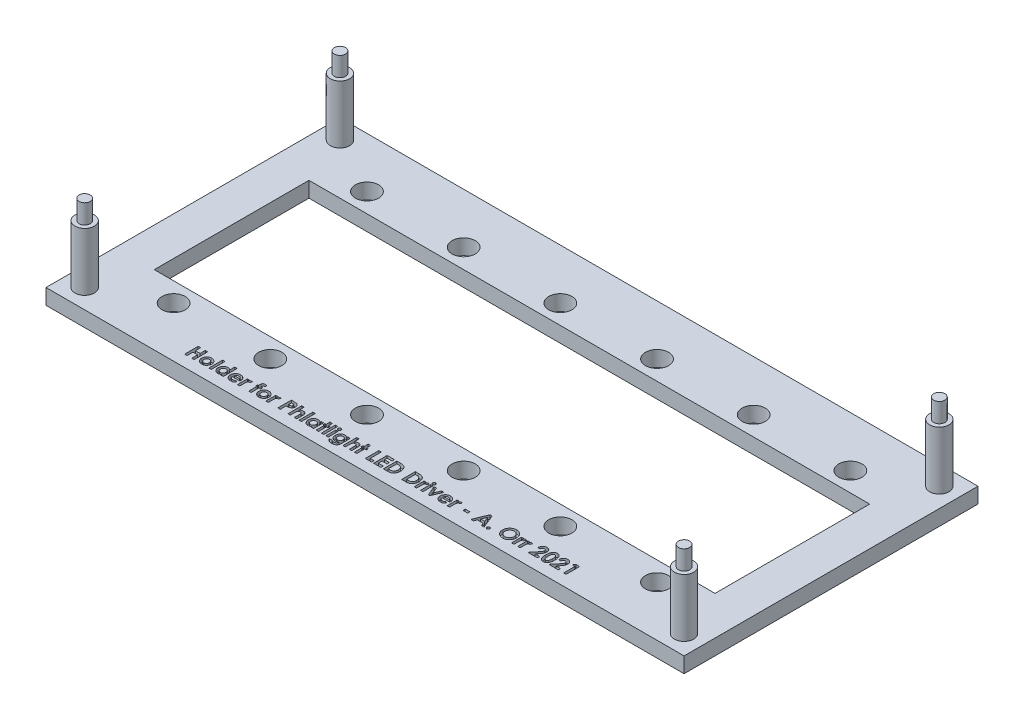
from build123d import *

# Parameters (mm, degrees)
SKETCH1_W           = 165
SKETCH1_H           = 76
BOSS_EXTRUDE1_DEPTH = 4
SKETCH2_R           = 2.5
BOSS_EXTRUDE2_DEPTH = 15
SKETCH3_R           = 1.45
BOSS_EXTRUDE3_DEPTH = 5
SKETCH4_R           = 3
CUT_EXTRUDE1_DEPTH  = 97.717859219
SKETCH5_W           = 145
SKETCH5_H           = 40
CUT_EXTRUDE2_DEPTH  = 97.717859219
SKETCH6_W           = 0.628205128
SKETCH6_H           = 3.58974359
SKETCH6_W_2         = 0.628205129
SKETCH6_H_2         = 2.557692308
SKETCH6_W_3         = 1.211538461
SKETCH6_H_3         = 0.583333333
CUT_EXTRUDE3_DEPTH  = 1


with BuildPart() as part:
    # Sketch1 → Boss-Extrude1 (new body)
    with BuildSketch(Plane(origin=(0, 0, 0), x_dir=(1, 0, 0), z_dir=(0, 1, 0))):
        with Locations((1.371565063, 5.81671902)):
            Rectangle(SKETCH1_W, SKETCH1_H)
    extrude(amount=BOSS_EXTRUDE1_DEPTH)

    # Sketch2 → Boss-Extrude2 (add)
    with BuildSketch(Plane(origin=(0, 4, 0), x_dir=(1, 0, 0), z_dir=(0, 1, 0))):
        with Locations((-76.128434937, -27.18328098)):
            Circle(SKETCH2_R)
        with Locations((78.871565063, -27.18328098)):
            Circle(SKETCH2_R)
        with Locations((78.871565063, 38.81671902)):
            Circle(SKETCH2_R)
        with Locations((-76.128434937, 38.81671902)):
            Circle(SKETCH2_R)
    extrude(amount=BOSS_EXTRUDE2_DEPTH)

    # Sketch3 → Boss-Extrude3 (add)
    with BuildSketch(Plane(origin=(0, 19, 0), x_dir=(1, 0, 0), z_dir=(0, 1, 0))):
        with Locations((78.871565063, 38.81671902)):
            Circle(SKETCH3_R)
        with Locations((-76.128434937, -27.18328098)):
            Circle(SKETCH3_R)
        with Locations((78.871565063, -27.18328098)):
            Circle(SKETCH3_R)
        with Locations((-76.128434937, 38.81671902)):
            Circle(SKETCH3_R)
    extrude(amount=BOSS_EXTRUDE3_DEPTH)

    # Sketch4 → Cut-Extrude1 (cut, through all)
    with BuildSketch(Plane(origin=(0, 4, 0), x_dir=(1, 0, 0), z_dir=(0, 1, 0))):
        with Locations((-61.128434937, 30.81671902)):
            Circle(SKETCH4_R)
        with Locations((-36.128434937, 30.81671902)):
            Circle(SKETCH4_R)
        with Locations((-11.128434937, 30.81671902)):
            Circle(SKETCH4_R)
        with Locations((13.871565063, 30.81671902)):
            Circle(SKETCH4_R)
        with Locations((38.871565063, 30.81671902)):
            Circle(SKETCH4_R)
        with Locations((63.871565063, 30.81671902)):
            Circle(SKETCH4_R)
        with Locations((63.871565063, -19.18328098)):
            Circle(SKETCH4_R)
        with Locations((38.871565063, -19.18328098)):
            Circle(SKETCH4_R)
        with Locations((13.871565063, -19.18328098)):
            Circle(SKETCH4_R)
        with Locations((-11.128434937, -19.18328098)):
            Circle(SKETCH4_R)
        with Locations((-36.128434937, -19.18328098)):
            Circle(SKETCH4_R)
        with Locations((-61.128434937, -19.18328098)):
            Circle(SKETCH4_R)
    extrude(amount=-CUT_EXTRUDE1_DEPTH, mode=Mode.SUBTRACT)

    # Sketch5 → Cut-Extrude2 (cut, through all)
    with BuildSketch(Plane(origin=(0, 4, 0), x_dir=(1, 0, 0), z_dir=(0, 1, 0))):
        with Locations((1.371565063, 5.81671902)):
            Rectangle(SKETCH5_W, SKETCH5_H)
    extrude(amount=-CUT_EXTRUDE2_DEPTH, mode=Mode.SUBTRACT)

    # Sketch6 → Cut-Extrude3 (cut)
    # profile 1 of 40: a face of its own
    with BuildSketch(Plane(origin=(0, 4, 0), x_dir=(1, 0, 0), z_dir=(0, 1, 0))):
        Polygon((-48.279075962, -25.68328098), (-47.650870834, -25.68328098), (-47.650870834, -27.029434826), (-46.439332373, -27.029434826), (-46.439332373, -25.68328098), (-45.811127245, -25.68328098), (-45.811127245, -29.18328098), (-46.439332373, -29.18328098), (-46.439332373, -27.657639954), (-47.650870834, -27.657639954), (-47.650870834, -29.18328098), (-48.279075962, -29.18328098), align=None)
    # profile 2 of 40: a face of its own
    with BuildSketch(Plane(origin=(0, 4, 0), x_dir=(1, 0, 0), z_dir=(0, 1, 0))):
        with BuildLine():
            add(Edge.make_bspline(
                [(-43.874628847, -26.580716877), (-43.844928521, -26.581245415), (-43.786108419, -26.582292159), (-43.698503224, -26.591005346), (-43.612429569, -26.605221271), (-43.527392716, -26.623628413), (-43.444182311, -26.649419571), (-43.362361924, -26.680352078), (-43.281199978, -26.715866212), (-43.202710896, -26.758140455), (-43.126327654, -26.803990726), (-43.053911794, -26.854567337), (-42.986064681, -26.909473027), (-42.921526841, -26.967434762), (-42.863305842, -27.030976009), (-42.807681049, -27.097035083), (-42.757657735, -27.16797865), (-42.711343351, -27.24207798), (-42.670109989, -27.318904571), (-42.634306397, -27.39792399), (-42.603232246, -27.478043738), (-42.578901808, -27.560239727), (-42.558758448, -27.643428094), (-42.546046556, -27.728628251), (-42.537009282, -27.814964978), (-42.535995917, -27.873093968), (-42.535486219, -27.90233146)],
                knots=[0, 0, 0, 0, 1.022364134, 2.024744242, 3.027414945, 4.024939316, 5.017584196, 6.023349371, 7.035562955, 8.064994934, 9.090267829, 10.101425541, 11.102933353, 12.093946398, 13.084502048, 14.067315274, 15.065326281, 16.070028806, 17.074376865, 18.064572984, 19.055292013, 20.030201733, 21.013838017, 21.999348303, 22.993720005, 24, 24, 24, 24], degree=3))
            add(Edge.make_bspline(
                [(-42.535486219, -27.90233146), (-42.536024121, -27.931797371), (-42.537093592, -27.990382281), (-42.545719598, -28.077531112), (-42.559989937, -28.163131925), (-42.578467726, -28.247689011), (-42.604162367, -28.33012038), (-42.634183812, -28.411641103), (-42.671036316, -28.491140022), (-42.711779475, -28.569484396), (-42.758391641, -28.644368789), (-42.808371654, -28.71602304), (-42.863763463, -28.782567321), (-42.921518387, -28.846065356), (-42.984375873, -28.904369926), (-43.051332598, -28.958427742), (-43.121808903, -29.008899683), (-43.196311587, -29.054601584), (-43.273886394, -29.094758215), (-43.353225041, -29.130962695), (-43.434791455, -29.161105509), (-43.51841683, -29.185686144), (-43.604151883, -29.204718314), (-43.691807333, -29.217647094), (-43.781194401, -29.226638911), (-43.841419889, -29.227644905), (-43.87182436, -29.228152775)],
                knots=[0, 0, 0, 0, 1.012026251, 2.012137606, 3.004615893, 3.992048833, 4.982446996, 5.968083444, 6.973977695, 7.990229942, 8.999482246, 10.001782172, 10.988562221, 11.971415814, 12.948383116, 13.930088534, 14.925840678, 15.924049238, 16.929462851, 17.924729459, 18.917889337, 19.913673841, 20.916777188, 21.931792057, 22.95587778, 24, 24, 24, 24], degree=3))
            add(Edge.make_bspline(
                [(-43.87182436, -29.228152775), (-43.916281897, -29.226847858), (-44.003908379, -29.224275848), (-44.132961471, -29.206658252), (-44.256938891, -29.17633375), (-44.376042659, -29.134062064), (-44.490427493, -29.079892473), (-44.599095135, -29.012849377), (-44.703126531, -28.934252665), (-44.80071978, -28.844766641), (-44.890128416, -28.746592369), (-44.968237616, -28.641791933), (-45.034558649, -28.531936113), (-45.089031844, -28.416899639), (-45.131074043, -28.296524763), (-45.161435683, -28.171171364), (-45.179074819, -28.040487092), (-45.181625076, -27.951696428), (-45.182922116, -27.906538191)],
                knots=[0, 0, 0, 0, 1.029999031, 2.030143771, 3.011211297, 3.982305373, 4.953580601, 5.938004764, 6.935448627, 7.970290061, 9.001484052, 10.007591832, 10.993831261, 11.969999897, 12.951306496, 13.942897864, 14.953773953, 16, 16, 16, 16], degree=3))
            add(Edge.make_bspline(
                [(-45.182922116, -27.906538191), (-45.181579844, -27.858319094), (-45.178941634, -27.763545422), (-45.157993089, -27.624699835), (-45.124540523, -27.491761764), (-45.076521471, -27.365103082), (-45.015181356, -27.244490182), (-44.940298977, -27.130177451), (-44.851504261, -27.022138995), (-44.783505288, -26.956793633), (-44.748927725, -26.923565435)],
                knots=[0, 0, 0, 0, 1.043912699, 2.05178951, 3.033892, 4.007821512, 4.978932272, 5.95884105, 6.962068106, 8, 8, 8, 8], degree=3))
            add(Edge.make_bspline(
                [(-44.748927725, -26.923565435), (-44.717199355, -26.896022996), (-44.654605849, -26.841687465), (-44.552912001, -26.772771752), (-44.448788977, -26.713249601), (-44.340988817, -26.664311323), (-44.229211001, -26.62741265), (-44.114028328, -26.600553718), (-43.995464748, -26.584056175), (-43.915112172, -26.581835633), (-43.874628847, -26.580716877)],
                knots=[0, 0, 0, 0, 1.048115528, 2.067714963, 3.060638214, 4.039924844, 5.017819947, 5.994373833, 6.98952318, 8, 8, 8, 8], degree=3))
        make_face()
        with BuildLine():
            add(Edge.make_bspline(
                [(-43.860606411, -27.16405021), (-43.88492879, -27.164858606), (-43.932807654, -27.166449941), (-44.0032866, -27.17499021), (-44.069946329, -27.192494225), (-44.134110828, -27.214754542), (-44.194645021, -27.244524579), (-44.253206723, -27.279362383), (-44.306750855, -27.322957607), (-44.357868588, -27.37077838), (-44.404272096, -27.423882064), (-44.443812291, -27.481738488), (-44.479142331, -27.542134186), (-44.505931309, -27.607280321), (-44.528101749, -27.675396259), (-44.543106437, -27.747582547), (-44.553548652, -27.823032824), (-44.554323839, -27.874716782), (-44.554716988, -27.900929217)],
                knots=[0, 0, 0, 0, 1.030650113, 2.02884584, 2.99876339, 3.944280128, 4.900564847, 5.851248946, 6.823638398, 7.81794922, 8.81432732, 9.802856497, 10.78262424, 11.771747962, 12.779760563, 13.812642396, 14.89064281, 16, 16, 16, 16], degree=3))
            add(Edge.make_bspline(
                [(-44.554716988, -27.900929217), (-44.55425695, -27.928066034), (-44.553357893, -27.981099733), (-44.544047971, -28.058536065), (-44.528695603, -28.132022631), (-44.506884699, -28.201445909), (-44.479453804, -28.267304212), (-44.445799278, -28.329228031), (-44.405565933, -28.38684504), (-44.359951086, -28.440084289), (-44.310004776, -28.488410145), (-44.255277515, -28.529881586), (-44.198061073, -28.565914765), (-44.137036874, -28.594854968), (-44.073071636, -28.617199154), (-44.005975473, -28.633650426), (-43.935395794, -28.642513574), (-43.887271607, -28.64404025), (-43.862709777, -28.644819441)],
                knots=[0, 0, 0, 0, 1.141730614, 2.231293227, 3.276944405, 4.297399982, 5.28939179, 6.275415646, 7.257752684, 8.24146775, 9.222424823, 10.176631434, 11.126518621, 12.063689483, 13.012557477, 13.974037417, 14.965980454, 16, 16, 16, 16], degree=3))
            add(Edge.make_bspline(
                [(-43.862709777, -28.644819441), (-43.838135661, -28.644128333), (-43.78995613, -28.642773361), (-43.719293568, -28.632626758), (-43.651854763, -28.616658005), (-43.587343212, -28.594121512), (-43.526280497, -28.564561858), (-43.468432865, -28.528356293), (-43.413291423, -28.486308021), (-43.362674829, -28.437070348), (-43.315820016, -28.383665064), (-43.274731147, -28.325743899), (-43.240395739, -28.263820065), (-43.212234556, -28.198283187), (-43.190380896, -28.129223347), (-43.175282689, -28.056383856), (-43.164834891, -27.97999045), (-43.164077236, -27.927608431), (-43.163691347, -27.900929217)],
                knots=[0, 0, 0, 0, 1.031504075, 2.022346795, 2.991027682, 3.937587355, 4.885570121, 5.833146507, 6.798790848, 7.791235734, 8.792807298, 9.778388351, 10.766749885, 11.760164525, 12.768777521, 13.802286646, 14.880660483, 16, 16, 16, 16], degree=3))
            add(Edge.make_bspline(
                [(-43.163691347, -27.900929217), (-43.164157238, -27.874259328), (-43.165071467, -27.821924353), (-43.174382052, -27.745427626), (-43.189583756, -27.672823573), (-43.211675973, -27.604422207), (-43.238943822, -27.539443177), (-43.27262161, -27.478219085), (-43.313053373, -27.421051477), (-43.358889967, -27.368223821), (-43.409585003, -27.320576087), (-43.463362067, -27.278085875), (-43.521450876, -27.242943205), (-43.582761647, -27.2139731), (-43.647457501, -27.19168474), (-43.715465805, -27.175140234), (-43.786994984, -27.166403205), (-43.835812826, -27.164842739), (-43.860606411, -27.16405021)],
                knots=[0, 0, 0, 0, 1.123894411, 2.205445421, 3.243160173, 4.246488011, 5.231014757, 6.210004299, 7.185865357, 8.177612767, 9.153374344, 10.115157457, 11.061423229, 12.009021698, 12.96873347, 13.94135618, 14.954456845, 16, 16, 16, 16], degree=3))
        make_face(mode=Mode.SUBTRACT)
    # profile 3 of 40: a face of its own
    with BuildSketch(Plane(origin=(0, 4, 0), x_dir=(1, 0, 0), z_dir=(0, 1, 0))):
        with Locations((-41.727793911, -27.388409185)):
            Rectangle(SKETCH6_W, SKETCH6_H)
    # profile 4 of 40: a face of its own
    with BuildSketch(Plane(origin=(0, 4, 0), x_dir=(1, 0, 0), z_dir=(0, 1, 0))):
        with BuildLine():
            Line((-38.900870834, -25.59353739), (-38.272665706, -25.59353739))
            Line((-38.272665706, -25.59353739), (-38.272665706, -29.18328098))
            Line((-38.272665706, -29.18328098), (-38.900870834, -29.18328098))
            Line((-38.900870834, -29.18328098), (-38.900870834, -28.904234505))
            add(Edge.make_bspline(
                [(-38.900870834, -28.904234505), (-38.931998167, -28.931396591), (-38.992410173, -28.984112836), (-39.087599945, -29.052513504), (-39.183067873, -29.108935215), (-39.279272683, -29.15387203), (-39.377693002, -29.187053243), (-39.479037417, -29.211077217), (-39.584765395, -29.225244742), (-39.656637818, -29.227173333), (-39.693138462, -29.228152775)],
                knots=[0, 0, 0, 0, 1.129196829, 2.191548051, 3.199897424, 4.157751732, 5.089409408, 6.034969131, 7.002052659, 8, 8, 8, 8], degree=3))
            add(Edge.make_bspline(
                [(-39.693138462, -29.228152775), (-39.734112059, -29.227230997), (-39.815078207, -29.225409512), (-39.93388704, -29.206235442), (-40.048608781, -29.176885255), (-40.159150306, -29.135351072), (-40.265310496, -29.081530913), (-40.367901797, -29.016829022), (-40.465165483, -28.938973975), (-40.55791124, -28.851334361), (-40.642828699, -28.754930163), (-40.717064343, -28.651099456), (-40.779639474, -28.541314851), (-40.83090393, -28.425940334), (-40.871230045, -28.305060584), (-40.899976794, -28.178292206), (-40.91693741, -28.045589925), (-40.919036656, -27.955198328), (-40.920101604, -27.909342678)],
                knots=[0, 0, 0, 0, 0.980476535, 1.937477201, 2.874147792, 3.812856188, 4.758993464, 5.720109578, 6.712210464, 7.737600662, 8.772720504, 9.783789959, 10.789002326, 11.793715968, 12.802552247, 13.835794126, 14.902098527, 16, 16, 16, 16], degree=3))
            add(Edge.make_bspline(
                [(-40.920101604, -27.909342678), (-40.918983937, -27.861859092), (-40.91679151, -27.768714748), (-40.900754037, -27.632029851), (-40.872537773, -27.502118262), (-40.834062869, -27.378800033), (-40.784571586, -27.262053861), (-40.72429451, -27.151688477), (-40.652411627, -27.04799236), (-40.569579349, -26.95273049), (-40.480140832, -26.865418384), (-40.384457431, -26.789406272), (-40.284025424, -26.724830446), (-40.178738085, -26.672111513), (-40.068610449, -26.631372989), (-39.954077298, -26.601589801), (-39.834630187, -26.583718842), (-39.753261847, -26.581725842), (-39.712068751, -26.580716877)],
                knots=[0, 0, 0, 0, 1.136281865, 2.228943489, 3.287578264, 4.313574083, 5.316051562, 6.317280042, 7.318008486, 8.329309503, 9.333984563, 10.305318864, 11.248632312, 12.186624717, 13.117503092, 14.05354244, 15.014596925, 16, 16, 16, 16], degree=3))
            add(Edge.make_bspline(
                [(-39.712068751, -26.580716877), (-39.673935197, -26.581926734), (-39.598526092, -26.584319226), (-39.487133855, -26.599379365), (-39.379953367, -26.627736294), (-39.275682926, -26.664272113), (-39.175676681, -26.713436862), (-39.079397347, -26.772495496), (-38.986591241, -26.842198044), (-38.92980553, -26.896100088), (-38.900870834, -26.923565435)],
                knots=[0, 0, 0, 0, 1.011899165, 2.001030639, 2.974036179, 3.948778736, 4.92769327, 5.924124564, 6.942254589, 8, 8, 8, 8], degree=3))
            Line((-38.900870834, -26.923565435), (-38.900870834, -25.59353739))
        make_face()
        with BuildLine():
            add(Edge.make_bspline(
                [(-39.580257854, -27.16405021), (-39.605289976, -27.164818282), (-39.654351302, -27.166323653), (-39.726502695, -27.175378564), (-39.795457783, -27.191333719), (-39.860724783, -27.214904036), (-39.923276412, -27.243616116), (-39.982162816, -27.279577523), (-40.03787, -27.322083142), (-40.090070345, -27.370103913), (-40.137658651, -27.42288752), (-40.178682549, -27.480485871), (-40.213546234, -27.541347019), (-40.24303185, -27.605653951), (-40.264136862, -27.674167618), (-40.280852023, -27.745996093), (-40.289526109, -27.821726179), (-40.291098447, -27.873333889), (-40.291896475, -27.899526973)],
                knots=[0, 0, 0, 0, 1.04836806, 2.054732945, 3.03993516, 4.00574415, 4.955904794, 5.917688631, 6.888591924, 7.88601754, 8.884115178, 9.859153345, 10.841239365, 11.818093293, 12.814750328, 13.83810466, 14.90274714, 16, 16, 16, 16], degree=3))
            add(Edge.make_bspline(
                [(-40.291896475, -27.899526973), (-40.291110638, -27.925957644), (-40.289562153, -27.978038974), (-40.280711771, -28.054407871), (-40.264598091, -28.127285591), (-40.241088839, -28.19608297), (-40.21237859, -28.26172831), (-40.17743176, -28.323918653), (-40.1345057, -28.381554395), (-40.086875677, -28.435999392), (-40.03360445, -28.484616662), (-39.977582052, -28.527784333), (-39.918043262, -28.563902696), (-39.855634033, -28.593093786), (-39.790564437, -28.61688207), (-39.7220187, -28.632636702), (-39.650668314, -28.642708341), (-39.602026871, -28.644110882), (-39.577453366, -28.644819441)],
                knots=[0, 0, 0, 0, 1.099136573, 2.165835871, 3.191374663, 4.196217796, 5.183857741, 6.167377911, 7.154730987, 8.166690795, 9.170734848, 10.148332609, 11.103258353, 12.059567475, 13.009337315, 13.978056681, 14.978520572, 16, 16, 16, 16], degree=3))
            add(Edge.make_bspline(
                [(-39.577453366, -28.644819441), (-39.551954991, -28.644047063), (-39.501964315, -28.642532783), (-39.428635808, -28.633560508), (-39.358754406, -28.617546851), (-39.292610853, -28.593841589), (-39.22919487, -28.565335605), (-39.169078729, -28.530076912), (-39.11291478, -28.487668831), (-39.060418579, -28.439213951), (-39.012315931, -28.385999335), (-38.970724705, -28.327645672), (-38.934497227, -28.266019275), (-38.906005981, -28.199663069), (-38.883379937, -28.12973798), (-38.867146272, -28.055810036), (-38.858316099, -27.977799535), (-38.856781158, -27.924554328), (-38.855999039, -27.897423608)],
                knots=[0, 0, 0, 0, 1.050008698, 2.058587853, 3.036635738, 3.995319155, 4.947022481, 5.895997462, 6.858296291, 7.838991643, 8.833936038, 9.806048392, 10.784806122, 11.771666913, 12.772873988, 13.80724452, 14.882696879, 16, 16, 16, 16], degree=3))
            add(Edge.make_bspline(
                [(-38.855999039, -27.897423608), (-38.856771439, -27.870759523), (-38.858280161, -27.81867682), (-38.867184354, -27.742295141), (-38.883533269, -27.669818805), (-38.905693632, -27.601114589), (-38.934691745, -27.536339587), (-38.970946635, -27.476211997), (-39.012081628, -27.418648625), (-39.060716843, -27.366871629), (-39.11292866, -27.3187676), (-39.16991859, -27.277641971), (-39.229891143, -27.242198762), (-39.293214789, -27.213098521), (-39.360475877, -27.191766941), (-39.430476701, -27.17525068), (-39.50430942, -27.166329088), (-39.554528578, -27.164822232), (-39.580257854, -27.16405021)],
                knots=[0, 0, 0, 0, 1.106611376, 2.161533483, 3.185006901, 4.184773755, 5.152708835, 6.122342771, 7.094156588, 8.082475533, 9.064254463, 10.03606828, 10.992420271, 11.951521816, 12.920622147, 13.915721683, 14.932141191, 16, 16, 16, 16], degree=3))
        make_face(mode=Mode.SUBTRACT)
    # profile 5 of 40: a face of its own
    with BuildSketch(Plane(origin=(0, 4, 0), x_dir=(1, 0, 0), z_dir=(0, 1, 0))):
        with BuildLine():
            Line((-35.088871636, -28.061486108), (-37.105999039, -28.061486108))
            add(Edge.make_bspline(
                [(-37.105999039, -28.061486108), (-37.10188628, -28.084923984), (-37.093804382, -28.13098126), (-37.076254254, -28.197883449), (-37.053857658, -28.260930943), (-37.027016749, -28.320208021), (-36.996184063, -28.376028057), (-36.96022029, -28.428129234), (-36.919581596, -28.476465531), (-36.874502945, -28.520826876), (-36.825735715, -28.560575603), (-36.773516409, -28.595398), (-36.71779114, -28.623950235), (-36.659198779, -28.648016807), (-36.597301503, -28.667079969), (-36.532008218, -28.68022747), (-36.463492004, -28.687993747), (-36.416816667, -28.68911705), (-36.392958174, -28.689691236)],
                knots=[0, 0, 0, 0, 1.091296461, 2.144483647, 3.168565212, 4.157007626, 5.126487748, 6.090021542, 7.05641414, 8.019231907, 8.98705074, 9.938580405, 10.892824166, 11.854447369, 12.841318655, 13.858982407, 14.905600794, 16, 16, 16, 16], degree=3))
            add(Edge.make_bspline(
                [(-36.392958174, -28.689691236), (-36.364159354, -28.688930919), (-36.307445996, -28.687433632), (-36.224360504, -28.674154916), (-36.14400473, -28.654098), (-36.067139123, -28.624271681), (-35.992873317, -28.587143158), (-35.922429953, -28.540885586), (-35.854589713, -28.486850764), (-35.813199172, -28.445200744), (-35.792096796, -28.423966076)],
                knots=[0, 0, 0, 0, 1.021034703, 2.010718019, 2.977989445, 3.954245119, 4.929443971, 5.918328161, 6.938689359, 8, 8, 8, 8], degree=3))
            Line((-35.792096796, -28.423966076), (-35.26625545, -28.674266557))
            add(Edge.make_bspline(
                [(-35.26625545, -28.674266557), (-35.282811258, -28.697144142), (-35.315615982, -28.742475237), (-35.369168594, -28.806267794), (-35.425054154, -28.865788838), (-35.483314343, -28.92064689), (-35.544023048, -28.970685626), (-35.607011392, -29.016514607), (-35.673199925, -29.056903345), (-35.741265219, -29.093805822), (-35.812614309, -29.125442145), (-35.88704974, -29.152420484), (-35.964256238, -29.176808673), (-36.045208753, -29.195391136), (-36.129233194, -29.210100863), (-36.216530565, -29.220546718), (-36.30708936, -29.226998622), (-36.368641645, -29.227763487), (-36.399969392, -29.228152775)],
                knots=[0, 0, 0, 0, 1.028154879, 2.037251081, 3.030720504, 4.000128189, 4.949298328, 5.894184978, 6.834267904, 7.770992897, 8.712077017, 9.673380525, 10.653304757, 11.658697181, 12.695551717, 13.758623199, 14.859225354, 16, 16, 16, 16], degree=3))
            add(Edge.make_bspline(
                [(-36.399969392, -29.228152775), (-36.448166617, -29.227170178), (-36.542558104, -29.22524582), (-36.680622717, -29.207385019), (-36.811745806, -29.177769887), (-36.936297617, -29.137512663), (-37.053739753, -29.084360516), (-37.164130337, -29.019351031), (-37.26857233, -28.943730569), (-37.363874444, -28.85591206), (-37.450697481, -28.760326833), (-37.526957439, -28.657674827), (-37.590770686, -28.548673232), (-37.643175408, -28.434043443), (-37.683906178, -28.313492054), (-37.713270701, -28.186966457), (-37.731271505, -28.054527085), (-37.733215682, -27.964321089), (-37.734204168, -27.918457262)],
                knots=[0, 0, 0, 0, 1.103565453, 2.161269334, 3.182010356, 4.179077853, 5.15417608, 6.128274628, 7.109042802, 8.101804412, 9.090965879, 10.063106201, 11.02526161, 11.978650795, 12.945248442, 13.93468508, 14.949922959, 16, 16, 16, 16], degree=3))
            add(Edge.make_bspline(
                [(-37.734204168, -27.918457262), (-37.733205953, -27.871427976), (-37.73124201, -27.778899969), (-37.713425688, -27.643402511), (-37.683824995, -27.514119609), (-37.642975079, -27.390873227), (-37.591365343, -27.273277904), (-37.526740182, -27.162362457), (-37.450735325, -27.057740739), (-37.364225066, -26.959902181), (-37.268519222, -26.871592193), (-37.166822722, -26.792890346), (-37.0579929, -26.727310743), (-36.943260715, -26.674322465), (-36.823360036, -26.631270826), (-36.696904978, -26.602623556), (-36.564857672, -26.583388629), (-36.474593042, -26.581617213), (-36.428715386, -26.580716877)],
                knots=[0, 0, 0, 0, 1.079208495, 2.12329425, 3.130605359, 4.119693003, 5.099659317, 6.073216462, 7.060498243, 8.06384408, 9.066070512, 10.045757761, 11.010926815, 11.975797609, 12.942977511, 13.929384301, 14.947594487, 16, 16, 16, 16], degree=3))
            add(Edge.make_bspline(
                [(-36.428715386, -26.580716877), (-36.380287263, -26.581714718), (-36.285203636, -26.583673875), (-36.146177445, -26.60138965), (-36.014183715, -26.631185372), (-35.888660077, -26.671094499), (-35.771209521, -26.725589325), (-35.659251302, -26.78899903), (-35.555470812, -26.866254085), (-35.458761862, -26.953642839), (-35.37146227, -27.050597633), (-35.295152754, -27.155920234), (-35.230222748, -27.268582757), (-35.177596333, -27.38904207), (-35.136907386, -27.516936544), (-35.107515681, -27.652100082), (-35.08965218, -27.795046782), (-35.08774418, -27.89293058), (-35.08676827, -27.942996525)],
                knots=[0, 0, 0, 0, 1.080001299, 2.120471247, 3.119684163, 4.095710327, 5.052285597, 6.002875087, 6.961153713, 7.931888285, 8.906493152, 9.865905668, 10.82813294, 11.801621613, 12.7925306, 13.817193356, 14.883530496, 16, 16, 16, 16], degree=3))
            Line((-35.08676827, -27.942996525), (-35.088871636, -28.061486108))
        make_face()
        with BuildLine():
            add(Edge.make_bspline(
                [(-35.714973398, -27.567896364), (-35.726828013, -27.53590556), (-35.750398076, -27.472299509), (-35.803641867, -27.384538678), (-35.874294674, -27.308534234), (-35.956468957, -27.241246897), (-36.05035822, -27.186632291), (-36.15300385, -27.147089543), (-36.263108423, -27.123379215), (-36.338854437, -27.12059841), (-36.377533495, -27.119178416)],
                knots=[0, 0, 0, 0, 0.954238005, 1.897273737, 2.851915805, 3.847685534, 4.862635127, 5.880135777, 6.917509367, 8, 8, 8, 8], degree=3))
            add(Edge.make_bspline(
                [(-36.377533495, -27.119178416), (-36.419777323, -27.120542493), (-36.502355211, -27.123208981), (-36.621468193, -27.151568054), (-36.733824488, -27.193893123), (-36.800063392, -27.237531168), (-36.833262661, -27.259402775)],
                knots=[0, 0, 0, 0, 1.044195649, 2.041185066, 3.018232172, 4, 4, 4, 4], degree=3))
            add(Edge.make_bspline(
                [(-36.833262661, -27.259402775), (-36.853976526, -27.276060669), (-36.898137426, -27.311574448), (-36.955489314, -27.382421066), (-37.011981402, -27.468200417), (-37.044100268, -27.533355893), (-37.061127245, -27.567896364)],
                knots=[0, 0, 0, 0, 0.82159062, 1.751589201, 2.808063854, 4, 4, 4, 4], degree=3))
            Line((-37.061127245, -27.567896364), (-35.714973398, -27.567896364))
        make_face(mode=Mode.SUBTRACT)
    # profile 6 of 40: a face of its own
    with BuildSketch(Plane(origin=(0, 4, 0), x_dir=(1, 0, 0), z_dir=(0, 1, 0))):
        with BuildLine():
            Line((-34.638050321, -26.625588672), (-34.099588783, -26.625588672))
            Line((-34.099588783, -26.625588672), (-34.099588783, -26.940392358))
            add(Edge.make_bspline(
                [(-34.099588783, -26.940392358), (-34.08435674, -26.912415668), (-34.054585079, -26.857734066), (-33.999892042, -26.784334845), (-33.937058466, -26.722520068), (-33.868342156, -26.670996825), (-33.793534845, -26.630839515), (-33.714639741, -26.60222237), (-33.632331789, -26.583625191), (-33.576184095, -26.581693295), (-33.54780593, -26.580716877)],
                knots=[0, 0, 0, 0, 1.09866127, 2.147379032, 3.14564304, 4.131443017, 5.102343063, 6.064490016, 7.021754664, 8, 8, 8, 8], degree=3))
            add(Edge.make_bspline(
                [(-33.54780593, -26.580716877), (-33.527199842, -26.581681782), (-33.485238489, -26.583646674), (-33.421283481, -26.59506862), (-33.356405715, -26.615721671), (-33.313710554, -26.634316998), (-33.291896475, -26.643817839)],
                knots=[0, 0, 0, 0, 0.931404136, 1.896671404, 2.925354185, 4, 4, 4, 4], degree=3))
            Line((-33.291896475, -26.643817839), (-33.486808334, -27.175969281))
            add(Edge.make_bspline(
                [(-33.486808334, -27.175969281), (-33.504230671, -27.16755165), (-33.536977958, -27.151729745), (-33.584521332, -27.133058266), (-33.627668915, -27.121665842), (-33.65502369, -27.119965993), (-33.667697757, -27.119178416)],
                knots=[0, 0, 0, 0, 1.214386998, 2.282580073, 3.20428172, 4, 4, 4, 4], degree=3))
            add(Edge.make_bspline(
                [(-33.667697757, -27.119178416), (-33.679664541, -27.119700306), (-33.703205267, -27.120726954), (-33.73795072, -27.129524983), (-33.7706737, -27.14469691), (-33.802951129, -27.164133655), (-33.832236672, -27.191152184), (-33.861504127, -27.222430929), (-33.887296176, -27.261048699), (-33.914514267, -27.304032239), (-33.937689498, -27.356644053), (-33.957561545, -27.419451717), (-33.975267699, -27.493181958), (-33.98745195, -27.578226249), (-33.999228518, -27.673761639), (-34.00623822, -27.780489346), (-34.01146264, -27.898071886), (-34.011782078, -27.980148743), (-34.011948559, -28.022924409)],
                knots=[0, 0, 0, 0, 0.544232178, 1.070598461, 1.618251235, 2.182094276, 2.777567932, 3.425210017, 4.127676488, 4.886675562, 5.738955394, 6.734782583, 7.883056018, 9.186093582, 10.642914445, 12.264202625, 14.053029461, 16, 16, 16, 16], degree=3))
            Line((-34.011948559, -28.022924409), (-34.009845193, -28.147724089))
            Line((-34.009845193, -28.147724089), (-34.009845193, -29.18328098))
            Line((-34.009845193, -29.18328098), (-34.638050321, -29.18328098))
            Line((-34.638050321, -29.18328098), (-34.638050321, -26.625588672))
        make_face()
    # profile 7 of 40: a face of its own
    with BuildSketch(Plane(origin=(0, 4, 0), x_dir=(1, 0, 0), z_dir=(0, 1, 0))):
        with BuildLine():
            Line((-31.945742629, -26.625588672), (-31.721383655, -26.625588672))
            add(Edge.make_bspline(
                [(-31.721383655, -26.625588672), (-31.721233721, -26.5849228), (-31.720950217, -26.508029166), (-31.71927589, -26.399126388), (-31.718146809, -26.303297005), (-31.716130021, -26.220555756), (-31.713291607, -26.151145006), (-31.710381933, -26.095068548), (-31.708202392, -26.051972573), (-31.705129528, -26.027755678), (-31.70385561, -26.017716076)],
                knots=[0, 0, 0, 0, 1.604323161, 3.033556972, 4.296844687, 5.385167547, 6.298701784, 7.037230881, 7.60086462, 8, 8, 8, 8], degree=3))
            add(Edge.make_bspline(
                [(-31.70385561, -26.017716076), (-31.697882056, -25.983271465), (-31.686237579, -25.916127263), (-31.647690598, -25.822541842), (-31.591678727, -25.741018227), (-31.532302706, -25.683474549), (-31.477276356, -25.644190937), (-31.431113821, -25.618533404), (-31.380920476, -25.596537056), (-31.326534147, -25.579289283), (-31.268472085, -25.565200057), (-31.206107699, -25.555405926), (-31.139783141, -25.550008501), (-31.094122941, -25.549120365), (-31.070742629, -25.548665595)],
                knots=[0, 0, 0, 0, 1.43722947, 2.801646624, 4.13175475, 5.486897933, 6.18427957, 6.91287343, 7.658885333, 8.438447905, 9.260561323, 10.118602268, 11.036630026, 12, 12, 12, 12], degree=3))
            add(Edge.make_bspline(
                [(-31.070742629, -25.548665595), (-31.034920147, -25.54978349), (-30.960309122, -25.552111839), (-30.84567535, -25.570935113), (-30.724056916, -25.599750498), (-30.642178235, -25.626564936), (-30.599588783, -25.64051255)],
                knots=[0, 0, 0, 0, 0.891275659, 1.856347963, 2.884972697, 4, 4, 4, 4], degree=3))
            Line((-30.599588783, -25.64051255), (-30.599588783, -26.129194441))
            add(Edge.make_bspline(
                [(-30.599588783, -26.129194441), (-30.622432267, -26.122878603), (-30.665999897, -26.110832888), (-30.728686814, -26.097461074), (-30.785169627, -26.089204012), (-30.820653404, -26.087789496), (-30.837269071, -26.087127133)],
                knots=[0, 0, 0, 0, 1.174725213, 2.24046353, 3.176077791, 4, 4, 4, 4], degree=3))
            add(Edge.make_bspline(
                [(-30.837269071, -26.087127133), (-30.855555782, -26.087512492), (-30.889822259, -26.088234594), (-30.937320583, -26.097421143), (-30.977989276, -26.111885772), (-30.99908361, -26.128405426), (-31.009043911, -26.136205659)],
                knots=[0, 0, 0, 0, 1.199997209, 2.248609783, 3.173030359, 4, 4, 4, 4], degree=3))
            add(Edge.make_bspline(
                [(-31.009043911, -26.136205659), (-31.015071135, -26.143904928), (-31.028387242, -26.160915128), (-31.040490729, -26.195625546), (-31.046635535, -26.239496451), (-31.047715197, -26.271963193), (-31.048306732, -26.289751332)],
                knots=[0, 0, 0, 0, 0.721105823, 1.593158367, 2.681320256, 4, 4, 4, 4], degree=3))
            Line((-31.048306732, -26.289751332), (-31.050410097, -26.625588672))
            Line((-31.050410097, -26.625588672), (-30.644460578, -26.625588672))
            Line((-30.644460578, -26.625588672), (-30.644460578, -27.16405021))
            Line((-30.644460578, -27.16405021), (-31.093178527, -27.16405021))
            Line((-31.093178527, -27.16405021), (-31.093178527, -29.18328098))
            Line((-31.093178527, -29.18328098), (-31.721383655, -29.18328098))
            Line((-31.721383655, -29.18328098), (-31.721383655, -27.16405021))
            Line((-31.721383655, -27.16405021), (-31.945742629, -27.16405021))
            Line((-31.945742629, -27.16405021), (-31.945742629, -26.625588672))
        make_face()
    # profile 8 of 40: a face of its own
    with BuildSketch(Plane(origin=(0, 4, 0), x_dir=(1, 0, 0), z_dir=(0, 1, 0))):
        with BuildLine():
            add(Edge.make_bspline(
                [(-29.066936539, -26.580716877), (-29.037236214, -26.581245415), (-28.978416111, -26.582292159), (-28.890810916, -26.591005346), (-28.804737262, -26.605221271), (-28.719700409, -26.623628413), (-28.636490003, -26.649419571), (-28.554669616, -26.680352078), (-28.47350767, -26.715866212), (-28.395018589, -26.758140455), (-28.318635346, -26.803990726), (-28.246219487, -26.854567337), (-28.178372373, -26.909473027), (-28.113834533, -26.967434762), (-28.055613534, -27.030976009), (-27.999988741, -27.097035083), (-27.949965427, -27.16797865), (-27.903651044, -27.24207798), (-27.862417681, -27.318904571), (-27.826614089, -27.39792399), (-27.795539938, -27.478043738), (-27.7712095, -27.560239727), (-27.75106614, -27.643428094), (-27.738354248, -27.728628251), (-27.729316974, -27.814964978), (-27.728303609, -27.873093968), (-27.727793911, -27.90233146)],
                knots=[0, 0, 0, 0, 1.022364134, 2.024744242, 3.027414945, 4.024939316, 5.017584196, 6.023349371, 7.035562955, 8.064994934, 9.090267829, 10.101425541, 11.102933353, 12.093946398, 13.084502048, 14.067315274, 15.065326281, 16.070028806, 17.074376865, 18.064572984, 19.055292013, 20.030201733, 21.013838017, 21.999348303, 22.993720005, 24, 24, 24, 24], degree=3))
            add(Edge.make_bspline(
                [(-27.727793911, -27.90233146), (-27.728331813, -27.931797371), (-27.729401285, -27.990382281), (-27.738027291, -28.077531112), (-27.75229763, -28.163131925), (-27.770775419, -28.247689011), (-27.796470059, -28.33012038), (-27.826491504, -28.411641103), (-27.863344009, -28.491140022), (-27.904087168, -28.569484396), (-27.950699333, -28.644368789), (-28.000679347, -28.71602304), (-28.056071155, -28.782567321), (-28.113826079, -28.846065356), (-28.176683565, -28.904369926), (-28.24364029, -28.958427742), (-28.314116595, -29.008899683), (-28.388619279, -29.054601584), (-28.466194086, -29.094758215), (-28.545532733, -29.130962695), (-28.627099147, -29.161105509), (-28.710724523, -29.185686144), (-28.796459576, -29.204718314), (-28.884115025, -29.217647094), (-28.973502094, -29.226638911), (-29.033727581, -29.227644905), (-29.064132052, -29.228152775)],
                knots=[0, 0, 0, 0, 1.012026251, 2.012137606, 3.004615893, 3.992048833, 4.982446996, 5.968083444, 6.973977695, 7.990229942, 8.999482246, 10.001782172, 10.988562221, 11.971415814, 12.948383116, 13.930088534, 14.925840678, 15.924049238, 16.929462851, 17.924729459, 18.917889337, 19.913673841, 20.916777188, 21.931792057, 22.95587778, 24, 24, 24, 24], degree=3))
            add(Edge.make_bspline(
                [(-29.064132052, -29.228152775), (-29.108589589, -29.226847858), (-29.196216072, -29.224275848), (-29.325269163, -29.206658252), (-29.449246583, -29.17633375), (-29.568350351, -29.134062064), (-29.682735186, -29.079892473), (-29.791402828, -29.012849377), (-29.895434224, -28.934252665), (-29.993027472, -28.844766641), (-30.082436108, -28.746592369), (-30.160545309, -28.641791933), (-30.226866341, -28.531936113), (-30.281339536, -28.416899639), (-30.323381735, -28.296524763), (-30.353743376, -28.171171364), (-30.371382511, -28.040487092), (-30.373932768, -27.951696428), (-30.375229809, -27.906538191)],
                knots=[0, 0, 0, 0, 1.029999031, 2.030143771, 3.011211297, 3.982305373, 4.953580601, 5.938004764, 6.935448627, 7.970290061, 9.001484052, 10.007591832, 10.993831261, 11.969999897, 12.951306496, 13.942897864, 14.953773953, 16, 16, 16, 16], degree=3))
            add(Edge.make_bspline(
                [(-30.375229809, -27.906538191), (-30.373887536, -27.858319094), (-30.371249327, -27.763545422), (-30.350300782, -27.624699835), (-30.316848215, -27.491761764), (-30.268829164, -27.365103082), (-30.207489048, -27.244490182), (-30.132606669, -27.130177451), (-30.043811953, -27.022138995), (-29.975812981, -26.956793633), (-29.941235418, -26.923565435)],
                knots=[0, 0, 0, 0, 1.043912699, 2.05178951, 3.033892, 4.007821512, 4.978932272, 5.95884105, 6.962068106, 8, 8, 8, 8], degree=3))
            add(Edge.make_bspline(
                [(-29.941235418, -26.923565435), (-29.909507047, -26.896022996), (-29.846913541, -26.841687465), (-29.745219694, -26.772771752), (-29.64109667, -26.713249601), (-29.533296509, -26.664311323), (-29.421518694, -26.62741265), (-29.30633602, -26.600553718), (-29.18777244, -26.584056175), (-29.107419864, -26.581835633), (-29.066936539, -26.580716877)],
                knots=[0, 0, 0, 0, 1.048115528, 2.067714963, 3.060638214, 4.039924844, 5.017819947, 5.994373833, 6.98952318, 8, 8, 8, 8], degree=3))
        make_face()
        with BuildLine():
            add(Edge.make_bspline(
                [(-29.052914104, -27.16405021), (-29.077236482, -27.164858606), (-29.125115346, -27.166449941), (-29.195594292, -27.17499021), (-29.262254022, -27.192494225), (-29.326418521, -27.214754542), (-29.386952713, -27.244524579), (-29.445514415, -27.279362383), (-29.499058547, -27.322957607), (-29.55017628, -27.37077838), (-29.596579788, -27.423882064), (-29.636119983, -27.481738488), (-29.671450023, -27.542134186), (-29.698239001, -27.607280321), (-29.720409441, -27.675396259), (-29.735414129, -27.747582547), (-29.745856344, -27.823032824), (-29.746631531, -27.874716782), (-29.74702468, -27.900929217)],
                knots=[0, 0, 0, 0, 1.030650113, 2.02884584, 2.99876339, 3.944280128, 4.900564847, 5.851248946, 6.823638398, 7.81794922, 8.81432732, 9.802856497, 10.78262424, 11.771747962, 12.779760563, 13.812642396, 14.89064281, 16, 16, 16, 16], degree=3))
            add(Edge.make_bspline(
                [(-29.74702468, -27.900929217), (-29.746564642, -27.928066034), (-29.745665585, -27.981099733), (-29.736355663, -28.058536065), (-29.721003295, -28.132022631), (-29.699192391, -28.201445909), (-29.671761496, -28.267304212), (-29.63810697, -28.329228031), (-29.597873626, -28.38684504), (-29.552258778, -28.440084289), (-29.502312468, -28.488410145), (-29.447585207, -28.529881586), (-29.390368765, -28.565914765), (-29.329344567, -28.594854968), (-29.265379329, -28.617199154), (-29.198283165, -28.633650426), (-29.127703486, -28.642513574), (-29.0795793, -28.64404025), (-29.055017469, -28.644819441)],
                knots=[0, 0, 0, 0, 1.141730614, 2.231293227, 3.276944405, 4.297399982, 5.28939179, 6.275415646, 7.257752684, 8.24146775, 9.222424823, 10.176631434, 11.126518621, 12.063689483, 13.012557477, 13.974037417, 14.965980454, 16, 16, 16, 16], degree=3))
            add(Edge.make_bspline(
                [(-29.055017469, -28.644819441), (-29.030443354, -28.644128333), (-28.982263822, -28.642773361), (-28.911601261, -28.632626758), (-28.844162455, -28.616658005), (-28.779650904, -28.594121512), (-28.718588189, -28.564561858), (-28.660740557, -28.528356293), (-28.605599115, -28.486308021), (-28.554982521, -28.437070348), (-28.508127708, -28.383665064), (-28.46703884, -28.325743899), (-28.432703432, -28.263820065), (-28.404542249, -28.198283187), (-28.382688588, -28.129223347), (-28.367590381, -28.056383856), (-28.357142583, -27.97999045), (-28.356384928, -27.927608431), (-28.355999039, -27.900929217)],
                knots=[0, 0, 0, 0, 1.031504075, 2.022346795, 2.991027682, 3.937587355, 4.885570121, 5.833146507, 6.798790848, 7.791235734, 8.792807298, 9.778388351, 10.766749885, 11.760164525, 12.768777521, 13.802286646, 14.880660483, 16, 16, 16, 16], degree=3))
            add(Edge.make_bspline(
                [(-28.355999039, -27.900929217), (-28.35646493, -27.874259328), (-28.357379159, -27.821924353), (-28.366689744, -27.745427626), (-28.381891449, -27.672823573), (-28.403983665, -27.604422207), (-28.431251514, -27.539443177), (-28.464929303, -27.478219085), (-28.505361065, -27.421051477), (-28.551197659, -27.368223821), (-28.601892695, -27.320576087), (-28.655669759, -27.278085875), (-28.713758568, -27.242943205), (-28.77506934, -27.2139731), (-28.839765193, -27.19168474), (-28.907773497, -27.175140234), (-28.979302676, -27.166403205), (-29.028120518, -27.164842739), (-29.052914104, -27.16405021)],
                knots=[0, 0, 0, 0, 1.123894411, 2.205445421, 3.243160173, 4.246488011, 5.231014757, 6.210004299, 7.185865357, 8.177612767, 9.153374344, 10.115157457, 11.061423229, 12.009021698, 12.96873347, 13.94135618, 14.954456845, 16, 16, 16, 16], degree=3))
        make_face(mode=Mode.SUBTRACT)
    # profile 9 of 40: a face of its own
    with BuildSketch(Plane(origin=(0, 4, 0), x_dir=(1, 0, 0), z_dir=(0, 1, 0))):
        with BuildLine():
            Line((-27.279075962, -26.625588672), (-26.740614424, -26.625588672))
            Line((-26.740614424, -26.625588672), (-26.740614424, -26.940392358))
            add(Edge.make_bspline(
                [(-26.740614424, -26.940392358), (-26.725382381, -26.912415668), (-26.69561072, -26.857734066), (-26.640917683, -26.784334845), (-26.578084107, -26.722520068), (-26.509367797, -26.670996825), (-26.434560486, -26.630839515), (-26.355665382, -26.60222237), (-26.27335743, -26.583625191), (-26.217209736, -26.581693295), (-26.188831571, -26.580716877)],
                knots=[0, 0, 0, 0, 1.09866127, 2.147379032, 3.14564304, 4.131443017, 5.102343063, 6.064490016, 7.021754664, 8, 8, 8, 8], degree=3))
            add(Edge.make_bspline(
                [(-26.188831571, -26.580716877), (-26.168225483, -26.581681782), (-26.12626413, -26.583646674), (-26.062309122, -26.59506862), (-25.997431356, -26.615721671), (-25.954736195, -26.634316998), (-25.932922116, -26.643817839)],
                knots=[0, 0, 0, 0, 0.931404136, 1.896671404, 2.925354185, 4, 4, 4, 4], degree=3))
            Line((-25.932922116, -26.643817839), (-26.127833975, -27.175969281))
            add(Edge.make_bspline(
                [(-26.127833975, -27.175969281), (-26.145256312, -27.16755165), (-26.178003599, -27.151729745), (-26.225546973, -27.133058266), (-26.268694556, -27.121665842), (-26.296049331, -27.119965993), (-26.308723398, -27.119178416)],
                knots=[0, 0, 0, 0, 1.214386998, 2.282580073, 3.20428172, 4, 4, 4, 4], degree=3))
            add(Edge.make_bspline(
                [(-26.308723398, -27.119178416), (-26.320690182, -27.119700306), (-26.344230908, -27.120726954), (-26.378976361, -27.129524983), (-26.411699342, -27.14469691), (-26.44397677, -27.164133655), (-26.473262313, -27.191152184), (-26.502529768, -27.222430929), (-26.528321817, -27.261048699), (-26.555539908, -27.304032239), (-26.578715139, -27.356644053), (-26.598587186, -27.419451717), (-26.61629334, -27.493181958), (-26.628477591, -27.578226249), (-26.640254159, -27.673761639), (-26.647263861, -27.780489346), (-26.652488281, -27.898071886), (-26.652807719, -27.980148743), (-26.6529742, -28.022924409)],
                knots=[0, 0, 0, 0, 0.544232178, 1.070598461, 1.618251235, 2.182094276, 2.777567932, 3.425210017, 4.127676488, 4.886675562, 5.738955394, 6.734782583, 7.883056018, 9.186093582, 10.642914445, 12.264202625, 14.053029461, 16, 16, 16, 16], degree=3))
            Line((-26.6529742, -28.022924409), (-26.650870834, -28.147724089))
            Line((-26.650870834, -28.147724089), (-26.650870834, -29.18328098))
            Line((-26.650870834, -29.18328098), (-27.279075962, -29.18328098))
            Line((-27.279075962, -29.18328098), (-27.279075962, -26.625588672))
        make_face()
    # profile 10 of 40: a face of its own
    with BuildSketch(Plane(origin=(0, 4, 0), x_dir=(1, 0, 0), z_dir=(0, 1, 0))):
        with BuildLine():
            Line((-24.182922116, -25.68328098), (-23.481800321, -25.68328098))
            add(Edge.make_bspline(
                [(-23.481800321, -25.68328098), (-23.435989933, -25.683486037), (-23.347612091, -25.683881635), (-23.220163972, -25.688678787), (-23.102586842, -25.697275576), (-22.994907714, -25.707899848), (-22.897170863, -25.722794664), (-22.809253893, -25.739870404), (-22.73113856, -25.760673626), (-22.661943997, -25.785366761), (-22.599844112, -25.814479003), (-22.541077592, -25.845485618), (-22.486972566, -25.882490921), (-22.43479819, -25.921506635), (-22.387537364, -25.966259918), (-22.342241675, -26.013772373), (-22.300829517, -26.065928306), (-22.263109003, -26.122096383), (-22.228890685, -26.181238858), (-22.198995273, -26.24346146), (-22.174745789, -26.30886265), (-22.154403488, -26.377019356), (-22.138064353, -26.447928609), (-22.127188504, -26.522026506), (-22.119801081, -26.598795668), (-22.119149243, -26.651044808), (-22.118819552, -26.677471685)],
                knots=[0, 0, 0, 0, 1.698747864, 3.27724071, 4.728299578, 6.070144658, 7.288476769, 8.393259625, 9.389771311, 10.283485332, 11.113357557, 11.931608583, 12.74405601, 13.541433047, 14.344816069, 15.154114104, 15.974336324, 16.810834471, 17.661136416, 18.50621059, 19.367396281, 20.244825668, 21.142564693, 22.063065223, 23.020325768, 24, 24, 24, 24], degree=3))
            add(Edge.make_bspline(
                [(-22.118819552, -26.677471685), (-22.119296573, -26.706707109), (-22.120233978, -26.76415831), (-22.129423564, -26.848374723), (-22.145122281, -26.928667448), (-22.165639683, -27.005713607), (-22.19424974, -27.078245621), (-22.226935388, -27.147994127), (-22.267149102, -27.213003589), (-22.313099698, -27.274087198), (-22.363282992, -27.331741593), (-22.418890333, -27.384302111), (-22.47886182, -27.432127057), (-22.5428503, -27.475717639), (-22.611096005, -27.514985926), (-22.683549693, -27.550299622), (-22.760706118, -27.580529288), (-22.814435531, -27.596339158), (-22.841676123, -27.604354698)],
                knots=[0, 0, 0, 0, 1.102006807, 2.165578795, 3.188629044, 4.184801286, 5.166646146, 6.124351954, 7.085497154, 8.042432466, 9.003981491, 9.963833307, 10.922997304, 11.89326795, 12.880200226, 13.889073926, 14.929769137, 16, 16, 16, 16], degree=3))
            add(Edge.make_bspline(
                [(-22.841676123, -27.604354698), (-22.859618344, -27.608818751), (-22.898486972, -27.618489329), (-22.962803876, -27.628307392), (-23.036922355, -27.637334498), (-23.121082082, -27.645092203), (-23.215331577, -27.650365634), (-23.319579583, -27.654483949), (-23.433873343, -27.65747839), (-23.513348704, -27.657584646), (-23.554716988, -27.657639954)],
                knots=[0, 0, 0, 0, 0.618981996, 1.340914327, 2.176866532, 3.120127938, 4.170906482, 5.338178032, 6.614476169, 8, 8, 8, 8], degree=3))
            Line((-23.554716988, -27.657639954), (-23.554716988, -29.18328098))
            Line((-23.554716988, -29.18328098), (-24.182922116, -29.18328098))
            Line((-24.182922116, -29.18328098), (-24.182922116, -25.68328098))
        make_face()
        with BuildLine():
            Line((-23.554716988, -27.029434826), (-23.332461379, -27.029434826))
            add(Edge.make_bspline(
                [(-23.332461379, -27.029434826), (-23.292018462, -27.029178386), (-23.217602894, -27.028706534), (-23.115977507, -27.021883273), (-23.034309391, -27.011462775), (-22.969790062, -26.996517372), (-22.918845942, -26.973835743), (-22.874909827, -26.94759737), (-22.8372247, -26.914419668), (-22.804594926, -26.876508466), (-22.778508406, -26.832946594), (-22.760418762, -26.784443374), (-22.748668086, -26.73201791), (-22.747582802, -26.695533257), (-22.74702468, -26.676770563)],
                knots=[0, 0, 0, 0, 1.8619151, 3.425951444, 4.686033666, 5.651700536, 6.461346321, 7.243864085, 7.999046032, 8.762387399, 9.539336099, 10.322741239, 11.137448474, 12, 12, 12, 12], degree=3))
            add(Edge.make_bspline(
                [(-22.74702468, -26.676770563), (-22.74757706, -26.660377841), (-22.748648811, -26.62857202), (-22.756522179, -26.582668331), (-22.769070062, -26.539876623), (-22.787251464, -26.5006438), (-22.810755711, -26.465036523), (-22.839412144, -26.43306882), (-22.872853045, -26.404056076), (-22.898671376, -26.388699187), (-22.911788302, -26.380897166)],
                knots=[0, 0, 0, 0, 1.102301479, 2.1387299, 3.123554645, 4.094223062, 5.036071848, 5.982632524, 6.975082478, 8, 8, 8, 8], degree=3))
            add(Edge.make_bspline(
                [(-22.911788302, -26.380897166), (-22.922899096, -26.375278119), (-22.946422922, -26.363381445), (-22.98648628, -26.349550692), (-23.032718783, -26.337882928), (-23.085432552, -26.328198797), (-23.144417298, -26.320682905), (-23.209662496, -26.314935129), (-23.281264162, -26.312623724), (-23.331058836, -26.311875772), (-23.357000642, -26.311486108)],
                knots=[0, 0, 0, 0, 0.656809284, 1.390599849, 2.23162475, 3.173112763, 4.218524733, 5.370385145, 6.63003504, 8, 8, 8, 8], degree=3))
            Line((-23.357000642, -26.311486108), (-23.554716988, -26.311486108))
            Line((-23.554716988, -26.311486108), (-23.554716988, -27.029434826))
        make_face(mode=Mode.SUBTRACT)
    # profile 11 of 40: a face of its own
    with BuildSketch(Plane(origin=(0, 4, 0), x_dir=(1, 0, 0), z_dir=(0, 1, 0))):
        with BuildLine():
            Line((-21.580358014, -25.59353739), (-20.952152886, -25.59353739))
            Line((-20.952152886, -25.59353739), (-20.952152886, -26.902531781))
            add(Edge.make_bspline(
                [(-20.952152886, -26.902531781), (-20.920508862, -26.876796992), (-20.858829176, -26.826635428), (-20.762051727, -26.761286813), (-20.66547445, -26.705521964), (-20.568072519, -26.660328367), (-20.470268497, -26.624912792), (-20.371893494, -26.599796657), (-20.272852805, -26.583318256), (-20.206457407, -26.581584928), (-20.173206571, -26.580716877)],
                knots=[0, 0, 0, 0, 1.13710654, 2.216417683, 3.252896077, 4.244436563, 5.207303112, 6.149540546, 7.073289332, 8, 8, 8, 8], degree=3))
            add(Edge.make_bspline(
                [(-20.173206571, -26.580716877), (-20.141387753, -26.581561163), (-20.078924741, -26.583218568), (-19.987287716, -26.595190236), (-19.899517746, -26.615790389), (-19.815398614, -26.644108872), (-19.735509043, -26.682193059), (-19.658810158, -26.726803876), (-19.586213629, -26.780251808), (-19.542042776, -26.821452081), (-19.519761059, -26.842235307)],
                knots=[0, 0, 0, 0, 1.056403236, 2.073808271, 3.062028718, 4.046096703, 5.014652014, 5.995532726, 6.988858718, 8, 8, 8, 8], degree=3))
            add(Edge.make_bspline(
                [(-19.519761059, -26.842235307), (-19.501461887, -26.861655328), (-19.464598041, -26.900777136), (-19.418685104, -26.968222228), (-19.379039742, -27.041686671), (-19.346734424, -27.121860803), (-19.322708462, -27.208781944), (-19.304107495, -27.301734027), (-19.293820765, -27.40173198), (-19.292551241, -27.470651813), (-19.291896475, -27.506197646)],
                knots=[0, 0, 0, 0, 0.887296576, 1.787466942, 2.706642908, 3.663267187, 4.658426068, 5.705361056, 6.816525637, 8, 8, 8, 8], degree=3))
            Line((-19.291896475, -27.506197646), (-19.291896475, -29.18328098))
            Line((-19.291896475, -29.18328098), (-19.920101604, -29.18328098))
            Line((-19.920101604, -29.18328098), (-19.920101604, -28.071301813))
            add(Edge.make_bspline(
                [(-19.920101604, -28.071301813), (-19.920223665, -28.036010951), (-19.920457304, -27.968460601), (-19.922555382, -27.871456525), (-19.92598161, -27.78333203), (-19.930667132, -27.704060485), (-19.937209146, -27.633973179), (-19.943643676, -27.572567753), (-19.952672829, -27.520138545), (-19.966192842, -27.463169228), (-19.988195467, -27.402235946), (-20.020168863, -27.337283686), (-20.062876534, -27.283678108), (-20.112300103, -27.239466946), (-20.1694453, -27.205723315), (-20.232266385, -27.180800855), (-20.301837318, -27.166785079), (-20.350060758, -27.164985644), (-20.375129648, -27.16405021)],
                knots=[0, 0, 0, 0, 1.461461505, 2.797388094, 4.017818807, 5.113567707, 6.085313608, 6.932873269, 7.669572396, 8.286941306, 9.355291607, 10.346554054, 11.270113241, 12.175128673, 13.078071705, 14.003657132, 14.962203834, 16, 16, 16, 16], degree=3))
            add(Edge.make_bspline(
                [(-20.375129648, -27.16405021), (-20.407786986, -27.165326893), (-20.471750063, -27.167827421), (-20.563475946, -27.193567359), (-20.648081005, -27.2342526), (-20.724577822, -27.290640513), (-20.79123668, -27.361268619), (-20.847086515, -27.444051813), (-20.892768623, -27.538162084), (-20.912513253, -27.60678892), (-20.92270577, -27.642215275)],
                knots=[0, 0, 0, 0, 0.993549393, 1.945978497, 2.879753144, 3.843180486, 4.826017097, 5.826060929, 6.877775219, 8, 8, 8, 8], degree=3))
            add(Edge.make_bspline(
                [(-20.92270577, -27.642215275), (-20.925243729, -27.653165045), (-20.931031105, -27.678134106), (-20.935463187, -27.720735612), (-20.942040327, -27.772233533), (-20.944321831, -27.832936471), (-20.948595629, -27.9027508), (-20.950132655, -27.981789474), (-20.95168005, -28.0701268), (-20.951990207, -28.132064487), (-20.952152886, -28.164551012)],
                knots=[0, 0, 0, 0, 0.514379255, 1.17295301, 1.959069106, 2.891908278, 3.953016936, 5.163065833, 6.51201855, 8, 8, 8, 8], degree=3))
            Line((-20.952152886, -28.164551012), (-20.952152886, -29.18328098))
            Line((-20.952152886, -29.18328098), (-21.580358014, -29.18328098))
            Line((-21.580358014, -29.18328098), (-21.580358014, -25.59353739))
        make_face()
    # profile 12 of 40: a face of its own
    with BuildSketch(Plane(origin=(0, 4, 0), x_dir=(1, 0, 0), z_dir=(0, 1, 0))):
        with Locations((-18.394460578, -27.388409185)):
            Rectangle(SKETCH6_W, SKETCH6_H)
    # profile 13 of 40: a face of its own
    with BuildSketch(Plane(origin=(0, 4, 0), x_dir=(1, 0, 0), z_dir=(0, 1, 0))):
        with BuildLine():
            Line((-15.567537501, -26.625588672), (-14.939332373, -26.625588672))
            Line((-14.939332373, -26.625588672), (-14.939332373, -29.18328098))
            Line((-14.939332373, -29.18328098), (-15.567537501, -29.18328098))
            Line((-15.567537501, -29.18328098), (-15.567537501, -28.904234505))
            add(Edge.make_bspline(
                [(-15.567537501, -28.904234505), (-15.598664834, -28.931396591), (-15.659076839, -28.984112836), (-15.754266612, -29.052513504), (-15.84973454, -29.108935215), (-15.94593935, -29.15387203), (-16.044359669, -29.187053243), (-16.145704083, -29.211077217), (-16.251432062, -29.225244742), (-16.323304485, -29.227173333), (-16.359805129, -29.228152775)],
                knots=[0, 0, 0, 0, 1.129196829, 2.191548051, 3.199897424, 4.157751732, 5.089409408, 6.034969131, 7.002052659, 8, 8, 8, 8], degree=3))
            add(Edge.make_bspline(
                [(-16.359805129, -29.228152775), (-16.400778725, -29.227230997), (-16.481744873, -29.225409512), (-16.600553707, -29.206235442), (-16.715275448, -29.176885255), (-16.825816973, -29.135351072), (-16.931977162, -29.081530913), (-17.034568464, -29.016829022), (-17.13183215, -28.938973975), (-17.224577907, -28.851334361), (-17.309495365, -28.754930163), (-17.383731009, -28.651099456), (-17.44630614, -28.541314851), (-17.497570597, -28.425940334), (-17.537896712, -28.305060584), (-17.566643461, -28.178292206), (-17.583604076, -28.045589925), (-17.585703323, -27.955198328), (-17.58676827, -27.909342678)],
                knots=[0, 0, 0, 0, 0.980476535, 1.937477201, 2.874147792, 3.812856188, 4.758993464, 5.720109578, 6.712210464, 7.737600662, 8.772720504, 9.783789959, 10.789002326, 11.793715968, 12.802552247, 13.835794126, 14.902098527, 16, 16, 16, 16], degree=3))
            add(Edge.make_bspline(
                [(-17.58676827, -27.909342678), (-17.585650604, -27.861859092), (-17.583458177, -27.768714748), (-17.567420704, -27.632029851), (-17.53920444, -27.502118262), (-17.500729536, -27.378800033), (-17.451238252, -27.262053861), (-17.390961176, -27.151688477), (-17.319078294, -27.04799236), (-17.236246015, -26.95273049), (-17.146807499, -26.865418384), (-17.051124098, -26.789406272), (-16.950692091, -26.724830446), (-16.845404751, -26.672111513), (-16.735277115, -26.631372989), (-16.620743965, -26.601589801), (-16.501296854, -26.583718842), (-16.419928513, -26.581725842), (-16.378735418, -26.580716877)],
                knots=[0, 0, 0, 0, 1.136281865, 2.228943489, 3.287578264, 4.313574083, 5.316051562, 6.317280042, 7.318008486, 8.329309503, 9.333984563, 10.305318864, 11.248632312, 12.186624717, 13.117503092, 14.05354244, 15.014596925, 16, 16, 16, 16], degree=3))
            add(Edge.make_bspline(
                [(-16.378735418, -26.580716877), (-16.340577264, -26.581509621), (-16.265076031, -26.583078175), (-16.154100097, -26.600109668), (-16.046469447, -26.625868593), (-15.942771211, -26.662570424), (-15.842154823, -26.708913953), (-15.746350948, -26.766985848), (-15.653263789, -26.834345375), (-15.596465986, -26.886954592), (-15.567537501, -26.91374973)],
                knots=[0, 0, 0, 0, 1.017011718, 2.012299608, 2.98747302, 3.965332399, 4.941441765, 5.936729654, 6.94912688, 8, 8, 8, 8], degree=3))
            Line((-15.567537501, -26.91374973), (-15.567537501, -26.625588672))
        make_face()
        with BuildLine():
            add(Edge.make_bspline(
                [(-16.24692452, -27.16405021), (-16.271956643, -27.164818282), (-16.321017968, -27.166323653), (-16.393169362, -27.175378564), (-16.46212445, -27.191333719), (-16.527391449, -27.214904036), (-16.589943079, -27.243616116), (-16.648829482, -27.279577523), (-16.704536666, -27.322083142), (-16.756737012, -27.370103913), (-16.804325318, -27.42288752), (-16.845349215, -27.480485871), (-16.8802129, -27.541347019), (-16.909698517, -27.605653951), (-16.930803529, -27.674167618), (-16.947518689, -27.745996093), (-16.956192776, -27.821726179), (-16.957765114, -27.873333889), (-16.958563142, -27.899526973)],
                knots=[0, 0, 0, 0, 1.04836806, 2.054732945, 3.03993516, 4.00574415, 4.955904794, 5.917688631, 6.888591924, 7.88601754, 8.884115178, 9.859153345, 10.841239365, 11.818093293, 12.814750328, 13.83810466, 14.90274714, 16, 16, 16, 16], degree=3))
            add(Edge.make_bspline(
                [(-16.958563142, -27.899526973), (-16.957777304, -27.925957644), (-16.95622882, -27.978038974), (-16.947378438, -28.054407871), (-16.931264758, -28.127285591), (-16.907755506, -28.19608297), (-16.879045257, -28.26172831), (-16.844098426, -28.323918653), (-16.801172367, -28.381554395), (-16.753542344, -28.435999392), (-16.700271117, -28.484616662), (-16.644248719, -28.527784333), (-16.584709928, -28.563902696), (-16.522300699, -28.593093786), (-16.457231104, -28.61688207), (-16.388685367, -28.632636702), (-16.31733498, -28.642708341), (-16.268693537, -28.644110882), (-16.244120033, -28.644819441)],
                knots=[0, 0, 0, 0, 1.099136573, 2.165835871, 3.191374663, 4.196217796, 5.183857741, 6.167377911, 7.154730987, 8.166690795, 9.170734848, 10.148332609, 11.103258353, 12.059567475, 13.009337315, 13.978056681, 14.978520572, 16, 16, 16, 16], degree=3))
            add(Edge.make_bspline(
                [(-16.244120033, -28.644819441), (-16.218621658, -28.644047063), (-16.168630981, -28.642532783), (-16.095302474, -28.633560508), (-16.025421073, -28.617546851), (-15.95927752, -28.593841589), (-15.895861537, -28.565335605), (-15.835745396, -28.530076912), (-15.779581447, -28.487668831), (-15.727085246, -28.439213951), (-15.678982597, -28.385999335), (-15.637391372, -28.327645672), (-15.601163893, -28.266019275), (-15.572672648, -28.199663069), (-15.550046603, -28.12973798), (-15.533812939, -28.055810036), (-15.524982766, -27.977799535), (-15.523447825, -27.924554328), (-15.522665706, -27.897423608)],
                knots=[0, 0, 0, 0, 1.050008698, 2.058587853, 3.036635738, 3.995319155, 4.947022481, 5.895997462, 6.858296291, 7.838991643, 8.833936038, 9.806048392, 10.784806122, 11.771666913, 12.772873988, 13.80724452, 14.882696879, 16, 16, 16, 16], degree=3))
            add(Edge.make_bspline(
                [(-15.522665706, -27.897423608), (-15.523438106, -27.870759523), (-15.524946828, -27.81867682), (-15.533851021, -27.742295141), (-15.550199935, -27.669818805), (-15.572360298, -27.601114589), (-15.601358412, -27.536339587), (-15.637613302, -27.476211997), (-15.678748295, -27.418648625), (-15.727383509, -27.366871629), (-15.779595326, -27.3187676), (-15.836585257, -27.277641971), (-15.896557809, -27.242198762), (-15.959881455, -27.213098521), (-16.027142543, -27.191766941), (-16.097143368, -27.17525068), (-16.170976087, -27.166329088), (-16.221195245, -27.164822232), (-16.24692452, -27.16405021)],
                knots=[0, 0, 0, 0, 1.106611376, 2.161533483, 3.185006901, 4.184773755, 5.152708835, 6.122342771, 7.094156588, 8.082475533, 9.064254463, 10.03606828, 10.992420271, 11.951521816, 12.920622147, 13.915721683, 14.932141191, 16, 16, 16, 16], degree=3))
        make_face(mode=Mode.SUBTRACT)
    # profile 14 of 40: a face of its own
    with BuildSketch(Plane(origin=(0, 4, 0), x_dir=(1, 0, 0), z_dir=(0, 1, 0))):
        Polygon((-14.26625545, -25.59353739), (-13.638050321, -25.59353739), (-13.638050321, -26.625588672), (-13.234204168, -26.625588672), (-13.234204168, -27.16405021), (-13.638050321, -27.16405021), (-13.638050321, -29.18328098), (-14.26625545, -29.18328098), (-14.26625545, -27.16405021), (-14.580358014, -27.16405021), (-14.580358014, -26.625588672), (-14.26625545, -26.625588672), align=None)
    # profile 15 of 40: a face of its own
    with BuildSketch(Plane(origin=(0, 4, 0), x_dir=(1, 0, 0), z_dir=(0, 1, 0))):
        with Locations((-12.60599904, -27.388409185)):
            Rectangle(SKETCH6_W_2, SKETCH6_H)
    # profile 16 of 40: a face of its own
    with BuildSketch(Plane(origin=(0, 4, 0), x_dir=(1, 0, 0), z_dir=(0, 1, 0))):
        with BuildLine():
            add(Edge.make_bspline(
                [(-11.440734616, -25.548665595), (-11.41365898, -25.549994028), (-11.360493359, -25.552602535), (-11.284326372, -25.578029672), (-11.214420514, -25.617936803), (-11.152621797, -25.672690338), (-11.101223403, -25.738076074), (-11.061953121, -25.811279752), (-11.040077283, -25.89238707), (-11.037039053, -25.948415157), (-11.035486219, -25.977051012)],
                knots=[0, 0, 0, 0, 0.989868614, 1.943702388, 2.910836514, 3.924849579, 4.949916355, 5.946401046, 6.950409252, 8, 8, 8, 8], degree=3))
            add(Edge.make_bspline(
                [(-11.035486219, -25.977051012), (-11.036983495, -26.005475836), (-11.039901009, -26.06086296), (-11.062456607, -26.140869208), (-11.100150716, -26.214037332), (-11.151965405, -26.278451968), (-11.213094143, -26.332323665), (-11.281472504, -26.372955286), (-11.356909591, -26.396967917), (-11.409250242, -26.39979448), (-11.435826764, -26.401229698)],
                knots=[0, 0, 0, 0, 1.05296456, 2.051751585, 3.055639087, 4.085634717, 5.099016424, 6.062201612, 7.016062274, 8, 8, 8, 8], degree=3))
            add(Edge.make_bspline(
                [(-11.435826764, -26.401229698), (-11.463138748, -26.399906013), (-11.516766908, -26.397306907), (-11.593558621, -26.371820277), (-11.664396844, -26.33222744), (-11.725927479, -26.276355205), (-11.777914499, -26.210504854), (-11.81546944, -26.135596931), (-11.838960984, -26.053935003), (-11.841749409, -25.997077102), (-11.843178527, -25.967936428)],
                knots=[0, 0, 0, 0, 0.989065327, 1.942068821, 2.907541208, 3.917690034, 4.939857478, 5.938239964, 6.943311734, 8, 8, 8, 8], degree=3))
            add(Edge.make_bspline(
                [(-11.843178527, -25.967936428), (-11.841623256, -25.939994274), (-11.838568153, -25.885105947), (-11.816561276, -25.805801882), (-11.77819146, -25.733828872), (-11.727163294, -25.669640084), (-11.665907378, -25.615907908), (-11.596043486, -25.577212782), (-11.520389105, -25.552835859), (-11.467560269, -25.550070036), (-11.440734616, -25.548665595)],
                knots=[0, 0, 0, 0, 1.038616768, 2.040212704, 3.031499824, 4.052181184, 5.074969369, 6.039807101, 7.004644834, 8, 8, 8, 8], degree=3))
        make_face()
    # profile 17 of 40: a face of its own
    with BuildSketch(Plane(origin=(0, 4, 0), x_dir=(1, 0, 0), z_dir=(0, 1, 0))):
        with Locations((-11.439332373, -27.904434826)):
            Rectangle(SKETCH6_W, SKETCH6_H_2)
    # profile 18 of 40: a face of its own
    with BuildSketch(Plane(origin=(0, 4, 0), x_dir=(1, 0, 0), z_dir=(0, 1, 0))):
        with BuildLine():
            Line((-8.657281091, -26.625588672), (-7.984204168, -26.625588672))
            Line((-7.984204168, -26.625588672), (-7.984204168, -28.807479698))
            add(Edge.make_bspline(
                [(-7.984204168, -28.807479698), (-7.985013031, -28.859619944), (-7.986574977, -28.960304808), (-7.998489951, -29.106223182), (-8.018359705, -29.241497541), (-8.046951579, -29.366319465), (-8.08387936, -29.480230173), (-8.129043438, -29.583608364), (-8.181525531, -29.677008426), (-8.224677494, -29.731584324), (-8.245722597, -29.758200851)],
                knots=[0, 0, 0, 0, 1.243822755, 2.401870584, 3.490053692, 4.503076575, 5.453444971, 6.342269266, 7.191528908, 8, 8, 8, 8], degree=3))
            add(Edge.make_bspline(
                [(-8.245722597, -29.758200851), (-8.275943656, -29.791349907), (-8.336232771, -29.857480191), (-8.442525861, -29.94093427), (-8.558973857, -30.012260972), (-8.686765129, -30.070716623), (-8.825747465, -30.115241181), (-8.975563833, -30.147306798), (-9.136309212, -30.167278775), (-9.247331744, -30.169380049), (-9.304416507, -30.170460467)],
                knots=[0, 0, 0, 0, 0.916003385, 1.827369254, 2.751972866, 3.703651841, 4.69362366, 5.730423306, 6.83304546, 8, 8, 8, 8], degree=3))
            add(Edge.make_bspline(
                [(-9.304416507, -30.170460467), (-9.364758405, -30.169526301), (-9.480811411, -30.167729661), (-9.647577188, -30.150154399), (-9.799484742, -30.121235518), (-9.937247427, -30.080521832), (-10.062148707, -30.027989402), (-10.176543904, -29.964999988), (-10.280213326, -29.889690958), (-10.374723983, -29.805031265), (-10.457883996, -29.709161737), (-10.528894489, -29.602960126), (-10.589391737, -29.487403274), (-10.619262941, -29.404766908), (-10.634444552, -29.362768159)],
                knots=[0, 0, 0, 0, 1.29412125, 2.488928388, 3.592140377, 4.607309753, 5.564519828, 6.493640275, 7.402258018, 8.307438948, 9.210158992, 10.116782752, 11.042881838, 12, 12, 12, 12], degree=3))
            Line((-10.634444552, -29.362768159), (-9.936127245, -29.362768159))
            add(Edge.make_bspline(
                [(-9.936127245, -29.362768159), (-9.919989878, -29.380533861), (-9.88751007, -29.416291034), (-9.830062142, -29.461664463), (-9.766511712, -29.500501906), (-9.696346058, -29.532303514), (-9.619272621, -29.556485784), (-9.535816052, -29.574857816), (-9.44560253, -29.585211418), (-9.38343537, -29.586475546), (-9.351391668, -29.587127133)],
                knots=[0, 0, 0, 0, 0.888971165, 1.789239437, 2.70354581, 3.646217955, 4.638595249, 5.694475788, 6.811630907, 8, 8, 8, 8], degree=3))
            add(Edge.make_bspline(
                [(-9.351391668, -29.587127133), (-9.310896854, -29.586370511), (-9.233555308, -29.584925428), (-9.124134083, -29.569125019), (-9.026418783, -29.545520133), (-8.941819977, -29.509995354), (-8.868832467, -29.467325207), (-8.80794311, -29.417758284), (-8.75766621, -29.363162027), (-8.724779857, -29.31180029), (-8.705237562, -29.265206866), (-8.691930425, -29.224974115), (-8.681824842, -29.178598568), (-8.672626095, -29.126948206), (-8.665749882, -29.069357601), (-8.661194303, -29.005948758), (-8.657243933, -28.937001045), (-8.657268431, -28.889050028), (-8.657281091, -28.864270563)],
                knots=[0, 0, 0, 0, 1.656375485, 3.163532, 4.516250129, 5.759907703, 6.905105653, 7.965920022, 8.961443813, 9.932912751, 10.442911961, 11.026787936, 11.664959534, 12.383728702, 13.174001396, 14.037595414, 14.985895623, 16, 16, 16, 16], degree=3))
            add(Edge.make_bspline(
                [(-8.657281091, -28.864270563), (-8.684802566, -28.891263234), (-8.73850779, -28.943936553), (-8.825689829, -29.011136366), (-8.914936085, -29.066641758), (-9.006759441, -29.110766115), (-9.102986055, -29.143086427), (-9.204181101, -29.166299056), (-9.311497064, -29.18044288), (-9.385235973, -29.182321349), (-9.422906091, -29.18328098)],
                knots=[0, 0, 0, 0, 1.082007397, 2.111422008, 3.08419067, 4.02964304, 4.965866572, 5.929243163, 6.942137121, 8, 8, 8, 8], degree=3))
            add(Edge.make_bspline(
                [(-9.422906091, -29.18328098), (-9.464573625, -29.182318381), (-9.546423439, -29.180427495), (-9.666643972, -29.162051781), (-9.781984882, -29.133460963), (-9.892756749, -29.093659871), (-9.997829267, -29.040818099), (-10.098697658, -28.977951129), (-10.193492535, -28.901757868), (-10.283521706, -28.816491672), (-10.364892143, -28.721714563), (-10.436493094, -28.619924076), (-10.496854492, -28.51182236), (-10.545942168, -28.397509907), (-10.585052496, -28.277466596), (-10.611968728, -28.151042541), (-10.628416638, -28.018451203), (-10.630551304, -27.928087734), (-10.631640065, -27.881998928)],
                knots=[0, 0, 0, 0, 1.007560175, 1.979205489, 2.935124557, 3.879618859, 4.820364716, 5.775815361, 6.749909327, 7.75781854, 8.772289371, 9.766897274, 10.764314289, 11.762244114, 12.772609037, 13.814079916, 14.885097635, 16, 16, 16, 16], degree=3))
            add(Edge.make_bspline(
                [(-10.631640065, -27.881998928), (-10.63068914, -27.832862019), (-10.628830676, -27.736830053), (-10.610612425, -27.596563103), (-10.582263946, -27.463348233), (-10.541795746, -27.337464101), (-10.488629613, -27.219448855), (-10.424380469, -27.10892802), (-10.349654391, -27.00463775), (-10.290502459, -26.942768905), (-10.260746636, -26.911646364)],
                knots=[0, 0, 0, 0, 1.104124469, 2.157873671, 3.173961494, 4.162551312, 5.124378318, 6.07778831, 7.033049473, 8, 8, 8, 8], degree=3))
            add(Edge.make_bspline(
                [(-10.260746636, -26.911646364), (-10.232508788, -26.885108902), (-10.176864699, -26.832815506), (-10.085775499, -26.7657144), (-9.99143702, -26.708161698), (-9.892555306, -26.661867038), (-9.789830044, -26.625000505), (-9.682653091, -26.599209439), (-9.57155736, -26.583307263), (-9.496109846, -26.581586784), (-9.45796218, -26.580716877)],
                knots=[0, 0, 0, 0, 1.042068658, 2.053448347, 3.038272799, 4.011764631, 4.986555969, 5.970496305, 6.973845226, 8, 8, 8, 8], degree=3))
            add(Edge.make_bspline(
                [(-9.45796218, -26.580716877), (-9.422164914, -26.581722052), (-9.351230363, -26.583713869), (-9.246136177, -26.597766984), (-9.144370768, -26.62259385), (-9.044819873, -26.656725572), (-8.946428337, -26.700939331), (-8.849281183, -26.758889979), (-8.751408783, -26.828182576), (-8.689305326, -26.882325045), (-8.657281091, -26.910244121)],
                knots=[0, 0, 0, 0, 0.968122651, 1.918396369, 2.861262201, 3.796768263, 4.761417965, 5.77287463, 6.85156174, 8, 8, 8, 8], degree=3))
            Line((-8.657281091, -26.910244121), (-8.657281091, -26.625588672))
        make_face()
        with BuildLine():
            add(Edge.make_bspline(
                [(-9.307922116, -27.16405021), (-9.332481983, -27.164841613), (-9.380834031, -27.16639968), (-9.451896278, -27.175177982), (-9.519334677, -27.191747871), (-9.583971147, -27.213263292), (-9.645019819, -27.242205795), (-9.702598709, -27.277517967), (-9.75739031, -27.318505654), (-9.807651124, -27.365942307), (-9.854239452, -27.417198695), (-9.893356638, -27.473609274), (-9.928217024, -27.531961931), (-9.955326145, -27.594604749), (-9.977743011, -27.659837735), (-9.991443274, -27.728988347), (-10.002390207, -27.800792644), (-10.003082171, -27.849934817), (-10.003434937, -27.87498771)],
                knots=[0, 0, 0, 0, 1.059154978, 2.085203149, 3.079850876, 4.048488546, 5.017545358, 5.985239295, 6.956545898, 7.961752598, 8.960830395, 9.936516972, 10.916356752, 11.886198968, 12.873933111, 13.883774911, 14.921139228, 16, 16, 16, 16], degree=3))
            add(Edge.make_bspline(
                [(-10.003434937, -27.87498771), (-10.003053082, -27.900967911), (-10.002303644, -27.951957255), (-9.991810827, -28.026239206), (-9.976821993, -28.097331503), (-9.954180125, -28.164366335), (-9.925834596, -28.228224505), (-9.891785037, -28.288874631), (-9.849752758, -28.344866597), (-9.803077348, -28.397432623), (-9.751441732, -28.444958324), (-9.69586056, -28.486295472), (-9.637478145, -28.521994353), (-9.575032451, -28.549828145), (-9.509874609, -28.572383169), (-9.441351098, -28.588762623), (-9.369619389, -28.59761235), (-9.320798287, -28.599161079), (-9.296003046, -28.599947646)],
                knots=[0, 0, 0, 0, 1.097915424, 2.154794285, 3.166904039, 4.167166757, 5.140698173, 6.119085138, 7.101657521, 8.095747232, 9.089148684, 10.06378348, 11.021581144, 11.977080764, 12.949256321, 13.934658686, 14.951055324, 16, 16, 16, 16], degree=3))
            add(Edge.make_bspline(
                [(-9.296003046, -28.599947646), (-9.271657099, -28.599565921), (-9.223922394, -28.598817479), (-9.154290956, -28.588318301), (-9.087763846, -28.573137376), (-9.02446088, -28.551428618), (-8.964733373, -28.523093977), (-8.907779851, -28.489280879), (-8.854808412, -28.448363183), (-8.804814441, -28.402102913), (-8.759698074, -28.350662718), (-8.719875425, -28.294927941), (-8.687162561, -28.234888517), (-8.659297893, -28.171495001), (-8.638666835, -28.103853151), (-8.623002084, -28.032634662), (-8.613813233, -27.957494521), (-8.612883316, -27.906095767), (-8.612409296, -27.879895563)],
                knots=[0, 0, 0, 0, 1.047368431, 2.053558439, 3.025081491, 3.983010266, 4.928381778, 5.867249904, 6.829345556, 7.804873619, 8.796055618, 9.770545002, 10.747991713, 11.735078325, 12.747239243, 13.787476531, 14.872179528, 16, 16, 16, 16], degree=3))
            add(Edge.make_bspline(
                [(-8.612409296, -27.879895563), (-8.612869182, -27.853926786), (-8.613767133, -27.803221445), (-8.623085744, -27.729036036), (-8.638614358, -27.658710881), (-8.65953119, -27.591665581), (-8.686790503, -27.528300516), (-8.720973562, -27.469205442), (-8.760063343, -27.413289143), (-8.806090203, -27.362456276), (-8.855700337, -27.315440636), (-8.910394272, -27.275666408), (-8.967436741, -27.240523335), (-9.028753714, -27.212663151), (-9.093583571, -27.190719753), (-9.162030435, -27.17570922), (-9.233745228, -27.16517611), (-9.282875361, -27.164430385), (-9.307922116, -27.16405021)],
                knots=[0, 0, 0, 0, 1.111098411, 2.169475416, 3.193737863, 4.190319778, 5.171520483, 6.139320596, 7.107999188, 8.085777416, 9.069626166, 10.027970922, 10.974971434, 11.932846196, 12.904000912, 13.89897495, 14.928888274, 16, 16, 16, 16], degree=3))
        make_face(mode=Mode.SUBTRACT)
    # profile 19 of 40: a face of its own
    with BuildSketch(Plane(origin=(0, 4, 0), x_dir=(1, 0, 0), z_dir=(0, 1, 0))):
        with BuildLine():
            Line((-7.355999039, -25.59353739), (-6.727793911, -25.59353739))
            Line((-6.727793911, -25.59353739), (-6.727793911, -26.902531781))
            add(Edge.make_bspline(
                [(-6.727793911, -26.902531781), (-6.696149887, -26.876796992), (-6.634470202, -26.826635428), (-6.537692753, -26.761286813), (-6.441115476, -26.705521964), (-6.343713544, -26.660328367), (-6.245909523, -26.624912792), (-6.147534519, -26.599796657), (-6.048493831, -26.583318256), (-5.982098433, -26.581584928), (-5.948847597, -26.580716877)],
                knots=[0, 0, 0, 0, 1.13710654, 2.216417683, 3.252896077, 4.244436563, 5.207303112, 6.149540546, 7.073289332, 8, 8, 8, 8], degree=3))
            add(Edge.make_bspline(
                [(-5.948847597, -26.580716877), (-5.917028779, -26.581561163), (-5.854565767, -26.583218568), (-5.762928742, -26.595190236), (-5.675158771, -26.615790389), (-5.591039639, -26.644108872), (-5.511150068, -26.682193059), (-5.434451184, -26.726803876), (-5.361854654, -26.780251808), (-5.317683801, -26.821452081), (-5.295402084, -26.842235307)],
                knots=[0, 0, 0, 0, 1.056403236, 2.073808271, 3.062028718, 4.046096703, 5.014652014, 5.995532726, 6.988858718, 8, 8, 8, 8], degree=3))
            add(Edge.make_bspline(
                [(-5.295402084, -26.842235307), (-5.277102913, -26.861655328), (-5.240239066, -26.900777136), (-5.19432613, -26.968222228), (-5.154680768, -27.041686671), (-5.122375449, -27.121860803), (-5.098349488, -27.208781944), (-5.079748521, -27.301734027), (-5.069461791, -27.40173198), (-5.068192266, -27.470651813), (-5.067537501, -27.506197646)],
                knots=[0, 0, 0, 0, 0.887296576, 1.787466942, 2.706642908, 3.663267187, 4.658426068, 5.705361056, 6.816525637, 8, 8, 8, 8], degree=3))
            Line((-5.067537501, -27.506197646), (-5.067537501, -29.18328098))
            Line((-5.067537501, -29.18328098), (-5.695742629, -29.18328098))
            Line((-5.695742629, -29.18328098), (-5.695742629, -28.071301813))
            add(Edge.make_bspline(
                [(-5.695742629, -28.071301813), (-5.695864691, -28.036010951), (-5.696098329, -27.968460601), (-5.698196408, -27.871456525), (-5.701622635, -27.78333203), (-5.706308158, -27.704060485), (-5.712850172, -27.633973179), (-5.719284702, -27.572567753), (-5.728313855, -27.520138545), (-5.741833868, -27.463169228), (-5.763836493, -27.402235946), (-5.795809889, -27.337283686), (-5.83851756, -27.283678108), (-5.887941128, -27.239466946), (-5.945086326, -27.205723315), (-6.00790741, -27.180800855), (-6.077478343, -27.166785079), (-6.125701783, -27.164985644), (-6.150770674, -27.16405021)],
                knots=[0, 0, 0, 0, 1.461461505, 2.797388094, 4.017818807, 5.113567707, 6.085313608, 6.932873269, 7.669572396, 8.286941306, 9.355291607, 10.346554054, 11.270113241, 12.175128673, 13.078071705, 14.003657132, 14.962203834, 16, 16, 16, 16], degree=3))
            add(Edge.make_bspline(
                [(-6.150770674, -27.16405021), (-6.183428012, -27.165326893), (-6.247391089, -27.167827421), (-6.339116972, -27.193567359), (-6.423722031, -27.2342526), (-6.500218847, -27.290640513), (-6.566877705, -27.361268619), (-6.622727541, -27.444051813), (-6.668409649, -27.538162084), (-6.688154278, -27.60678892), (-6.698346796, -27.642215275)],
                knots=[0, 0, 0, 0, 0.993549393, 1.945978497, 2.879753144, 3.843180486, 4.826017097, 5.826060929, 6.877775219, 8, 8, 8, 8], degree=3))
            add(Edge.make_bspline(
                [(-6.698346796, -27.642215275), (-6.700884754, -27.653165045), (-6.706672131, -27.678134106), (-6.711104213, -27.720735612), (-6.717681352, -27.772233533), (-6.719962857, -27.832936471), (-6.724236655, -27.9027508), (-6.72577368, -27.981789474), (-6.727321075, -28.0701268), (-6.727631233, -28.132064487), (-6.727793911, -28.164551012)],
                knots=[0, 0, 0, 0, 0.514379255, 1.17295301, 1.959069106, 2.891908278, 3.953016936, 5.163065833, 6.51201855, 8, 8, 8, 8], degree=3))
            Line((-6.727793911, -28.164551012), (-6.727793911, -29.18328098))
            Line((-6.727793911, -29.18328098), (-7.355999039, -29.18328098))
            Line((-7.355999039, -29.18328098), (-7.355999039, -25.59353739))
        make_face()
    # profile 20 of 40: a face of its own
    with BuildSketch(Plane(origin=(0, 4, 0), x_dir=(1, 0, 0), z_dir=(0, 1, 0))):
        Polygon((-4.394460578, -25.59353739), (-3.76625545, -25.59353739), (-3.76625545, -26.625588672), (-3.362409296, -26.625588672), (-3.362409296, -27.16405021), (-3.76625545, -27.16405021), (-3.76625545, -29.18328098), (-4.394460578, -29.18328098), (-4.394460578, -27.16405021), (-4.708563142, -27.16405021), (-4.708563142, -26.625588672), (-4.394460578, -26.625588672), align=None)
    # profile 21 of 40: a face of its own
    with BuildSketch(Plane(origin=(0, 4, 0), x_dir=(1, 0, 0), z_dir=(0, 1, 0))):
        Polygon((-1.567537501, -25.68328098), (-0.939332373, -25.68328098), (-0.939332373, -28.555075851), (0.047847114, -28.555075851), (0.047847114, -29.18328098), (-1.567537501, -29.18328098), align=None)
    # profile 22 of 40: a face of its own
    with BuildSketch(Plane(origin=(0, 4, 0), x_dir=(1, 0, 0), z_dir=(0, 1, 0))):
        Polygon((0.586308653, -25.68328098), (2.470924038, -25.68328098), (2.470924038, -26.311486108), (1.214513781, -26.311486108), (1.214513781, -26.984563031), (2.470924038, -26.984563031), (2.470924038, -27.612768159), (1.214513781, -27.612768159), (1.214513781, -28.555075851), (2.470924038, -28.555075851), (2.470924038, -29.18328098), (0.586308653, -29.18328098), align=None)
    # profile 23 of 40: a face of its own
    with BuildSketch(Plane(origin=(0, 4, 0), x_dir=(1, 0, 0), z_dir=(0, 1, 0))):
        with BuildLine():
            Line((3.099129166, -25.68328098), (3.890695672, -25.68328098))
            add(Edge.make_bspline(
                [(3.890695672, -25.68328098), (3.952407386, -25.683712366), (4.071696826, -25.68454624), (4.244523626, -25.693941994), (4.405230557, -25.708391998), (4.553921215, -25.728270597), (4.690290759, -25.754575427), (4.814163343, -25.787569681), (4.925954715, -25.825656058), (5.026890642, -25.870472409), (5.119035435, -25.922723824), (5.206529857, -25.980927704), (5.289202114, -26.04721623), (5.368212382, -26.120310562), (5.442541015, -26.201547939), (5.513425851, -26.289582776), (5.579131309, -26.385691699), (5.641643522, -26.48757032), (5.6981775, -26.595650391), (5.747488549, -26.709011956), (5.788796713, -26.826925491), (5.822361736, -26.949516662), (5.849116932, -27.076378503), (5.867837004, -27.207767009), (5.879409939, -27.343560538), (5.880583917, -27.435594479), (5.881180448, -27.482359505)],
                knots=[0, 0, 0, 0, 1.44355588, 2.790409838, 4.047694926, 5.217575253, 6.298404546, 7.294384826, 8.214239204, 9.058592145, 9.873746385, 10.689560431, 11.514393297, 12.350027578, 13.205127629, 14.088021785, 14.991911688, 15.926770944, 16.882954281, 17.842803888, 18.816321264, 19.80318086, 20.814351908, 21.847355356, 22.906180909, 24, 24, 24, 24], degree=3))
            add(Edge.make_bspline(
                [(5.881180448, -27.482359505), (5.879618408, -27.548348001), (5.876543441, -27.678250217), (5.850641637, -27.868880222), (5.808749651, -28.051618096), (5.749845713, -28.22503439), (5.676820597, -28.387584809), (5.58958392, -28.536402843), (5.489414774, -28.670689712), (5.377480134, -28.789776778), (5.256282181, -28.892133726), (5.130333068, -28.979794961), (4.998405822, -29.048923159), (4.88215948, -29.092760774), (4.7813594, -29.120023978), (4.692858019, -29.136136794), (4.592329481, -29.150913219), (4.478836445, -29.162332121), (4.352876778, -29.172514976), (4.213948405, -29.178047944), (4.062501136, -29.182645018), (3.957306688, -29.183063438), (3.902614743, -29.18328098)],
                knots=[0, 0, 0, 0, 1.315458931, 2.589557908, 3.828601765, 5.048913369, 6.235739168, 7.376350998, 8.481830359, 9.569842114, 10.627874879, 11.640079404, 12.624025415, 13.590060155, 14.111227486, 14.704434459, 15.382649715, 16.137166398, 16.978595427, 17.902333227, 18.909396075, 20, 20, 20, 20], degree=3))
            Line((3.902614743, -29.18328098), (3.099129166, -29.18328098))
            Line((3.099129166, -29.18328098), (3.099129166, -25.68328098))
        make_face()
        with BuildLine():
            Line((3.727334294, -26.311486108), (3.727334294, -28.555075851))
            Line((3.727334294, -28.555075851), (4.055459294, -28.555075851))
            add(Edge.make_bspline(
                [(4.055459294, -28.555075851), (4.09450113, -28.555004311), (4.169591577, -28.554866714), (4.278005185, -28.54831286), (4.378260284, -28.541734598), (4.470080894, -28.529248837), (4.554135257, -28.515340578), (4.629268687, -28.495985331), (4.69703001, -28.475654284), (4.756591534, -28.44977034), (4.811145037, -28.42063624), (4.86165535, -28.386502263), (4.910411943, -28.348597769), (4.956503274, -28.305807933), (5.000103786, -28.258699373), (5.040955511, -28.207029359), (5.079603713, -28.150955538), (5.115056364, -28.090181433), (5.147453186, -28.025348834), (5.176192797, -27.957085737), (5.200022176, -27.884823659), (5.219827697, -27.80923906), (5.233980987, -27.72967389), (5.245690136, -27.646717477), (5.251726543, -27.560041154), (5.252555002, -27.501063687), (5.25297532, -27.471141557)],
                knots=[0, 0, 0, 0, 1.50275155, 2.890291501, 4.180787663, 5.369391935, 6.45668281, 7.458360028, 8.354766181, 9.177074746, 9.954075863, 10.732690366, 11.5210699, 12.329727389, 13.151100085, 13.990027547, 14.863562427, 15.770965086, 16.696477834, 17.652329173, 18.619756807, 19.62365428, 20.657822005, 21.729286259, 22.847956731, 24, 24, 24, 24], degree=3))
            add(Edge.make_bspline(
                [(5.25297532, -27.471141557), (5.25213819, -27.42528872), (5.250505851, -27.335879241), (5.234763932, -27.205652383), (5.209139091, -27.083024288), (5.172574911, -26.968450061), (5.126484629, -26.861607688), (5.068791898, -26.763402351), (5.001979589, -26.672184335), (4.949146239, -26.618672919), (4.922746954, -26.591934826)],
                knots=[0, 0, 0, 0, 1.13821349, 2.219428113, 3.251817212, 4.244760574, 5.201143372, 6.134805572, 7.068016741, 8, 8, 8, 8], degree=3))
            add(Edge.make_bspline(
                [(4.922746954, -26.591934826), (4.89671476, -26.569150355), (4.843546951, -26.522615655), (4.750201751, -26.466855183), (4.647340174, -26.417864143), (4.532609057, -26.379019711), (4.407117225, -26.348299879), (4.270117245, -26.327113162), (4.122342783, -26.313498802), (4.019968079, -26.312171379), (3.967117948, -26.311486108)],
                knots=[0, 0, 0, 0, 0.813307809, 1.661089106, 2.549956539, 3.493439533, 4.508053171, 5.589449661, 6.755572447, 8, 8, 8, 8], degree=3))
            Line((3.967117948, -26.311486108), (3.727334294, -26.311486108))
        make_face(mode=Mode.SUBTRACT)
    # profile 24 of 40: a face of its own
    with BuildSketch(Plane(origin=(0, 4, 0), x_dir=(1, 0, 0), z_dir=(0, 1, 0))):
        with BuildLine():
            Line((7.855539422, -25.68328098), (8.647105929, -25.68328098))
            add(Edge.make_bspline(
                [(8.647105929, -25.68328098), (8.708817642, -25.683712366), (8.828107083, -25.68454624), (9.000933883, -25.693941994), (9.161640814, -25.708391998), (9.310331471, -25.728270597), (9.446701015, -25.754575427), (9.5705736, -25.787569681), (9.682364971, -25.825656058), (9.783300898, -25.870472409), (9.875445691, -25.922723824), (9.962940113, -25.980927704), (10.045612371, -26.04721623), (10.124622638, -26.120310562), (10.198951271, -26.201547939), (10.269836108, -26.289582776), (10.335541565, -26.385691699), (10.398053778, -26.48757032), (10.454587757, -26.595650391), (10.503898805, -26.709011956), (10.545206969, -26.826925491), (10.578771992, -26.949516662), (10.605527189, -27.076378503), (10.624247261, -27.207767009), (10.635820196, -27.343560538), (10.636994173, -27.435594479), (10.637590704, -27.482359505)],
                knots=[0, 0, 0, 0, 1.44355588, 2.790409838, 4.047694926, 5.217575253, 6.298404546, 7.294384826, 8.214239204, 9.058592145, 9.873746385, 10.689560431, 11.514393297, 12.350027578, 13.205127629, 14.088021785, 14.991911688, 15.926770944, 16.882954281, 17.842803888, 18.816321264, 19.80318086, 20.814351908, 21.847355356, 22.906180909, 24, 24, 24, 24], degree=3))
            add(Edge.make_bspline(
                [(10.637590704, -27.482359505), (10.636028664, -27.548348001), (10.632953697, -27.678250217), (10.607051894, -27.868880222), (10.565159907, -28.051618096), (10.506255969, -28.22503439), (10.433230854, -28.387584809), (10.345994177, -28.536402843), (10.24582503, -28.670689712), (10.133890391, -28.789776778), (10.012692438, -28.892133726), (9.886743325, -28.979794961), (9.754816078, -29.048923159), (9.638569737, -29.092760774), (9.537769656, -29.120023978), (9.449268276, -29.136136794), (9.348739738, -29.150913219), (9.235246701, -29.162332121), (9.109287034, -29.172514976), (8.970358662, -29.178047944), (8.818911393, -29.182645018), (8.713716945, -29.183063438), (8.659024999, -29.18328098)],
                knots=[0, 0, 0, 0, 1.315458931, 2.589557908, 3.828601765, 5.048913369, 6.235739168, 7.376350998, 8.481830359, 9.569842114, 10.627874879, 11.640079404, 12.624025415, 13.590060155, 14.111227486, 14.704434459, 15.382649715, 16.137166398, 16.978595427, 17.902333227, 18.909396075, 20, 20, 20, 20], degree=3))
            Line((8.659024999, -29.18328098), (7.855539422, -29.18328098))
            Line((7.855539422, -29.18328098), (7.855539422, -25.68328098))
        make_face()
        with BuildLine():
            Line((8.48374455, -26.311486108), (8.48374455, -28.555075851))
            Line((8.48374455, -28.555075851), (8.81186955, -28.555075851))
            add(Edge.make_bspline(
                [(8.81186955, -28.555075851), (8.850911386, -28.555004311), (8.926001833, -28.554866714), (9.034415442, -28.54831286), (9.13467054, -28.541734598), (9.226491151, -28.529248837), (9.310545514, -28.515340578), (9.385678944, -28.495985331), (9.453440267, -28.475654284), (9.513001791, -28.44977034), (9.567555294, -28.42063624), (9.618065606, -28.386502263), (9.6668222, -28.348597769), (9.71291353, -28.305807933), (9.756514042, -28.258699373), (9.797365768, -28.207029359), (9.836013969, -28.150955538), (9.87146662, -28.090181433), (9.903863442, -28.025348834), (9.932603054, -27.957085737), (9.956432433, -27.884823659), (9.976237953, -27.80923906), (9.990391244, -27.72967389), (10.002100392, -27.646717477), (10.008136799, -27.560041154), (10.008965258, -27.501063687), (10.009385576, -27.471141557)],
                knots=[0, 0, 0, 0, 1.50275155, 2.890291501, 4.180787663, 5.369391935, 6.45668281, 7.458360028, 8.354766181, 9.177074746, 9.954075863, 10.732690366, 11.5210699, 12.329727389, 13.151100085, 13.990027547, 14.863562427, 15.770965086, 16.696477834, 17.652329173, 18.619756807, 19.62365428, 20.657822005, 21.729286259, 22.847956731, 24, 24, 24, 24], degree=3))
            add(Edge.make_bspline(
                [(10.009385576, -27.471141557), (10.008548446, -27.42528872), (10.006916108, -27.335879241), (9.991174188, -27.205652383), (9.965549347, -27.083024288), (9.928985167, -26.968450061), (9.882894886, -26.861607688), (9.825202154, -26.763402351), (9.758389846, -26.672184335), (9.705556495, -26.618672919), (9.679157211, -26.591934826)],
                knots=[0, 0, 0, 0, 1.13821349, 2.219428113, 3.251817212, 4.244760574, 5.201143372, 6.134805572, 7.068016741, 8, 8, 8, 8], degree=3))
            add(Edge.make_bspline(
                [(9.679157211, -26.591934826), (9.653125016, -26.569150355), (9.599957208, -26.522615655), (9.506612007, -26.466855183), (9.40375043, -26.417864143), (9.289019313, -26.379019711), (9.163527481, -26.348299879), (9.026527502, -26.327113162), (8.87875304, -26.313498802), (8.776378336, -26.312171379), (8.723528204, -26.311486108)],
                knots=[0, 0, 0, 0, 0.813307809, 1.661089106, 2.549956539, 3.493439533, 4.508053171, 5.589449661, 6.755572447, 8, 8, 8, 8], degree=3))
            Line((8.723528204, -26.311486108), (8.48374455, -26.311486108))
        make_face(mode=Mode.SUBTRACT)
    # profile 25 of 40: a face of its own
    with BuildSketch(Plane(origin=(0, 4, 0), x_dir=(1, 0, 0), z_dir=(0, 1, 0))):
        with BuildLine():
            Line((11.086308653, -26.625588672), (11.624770191, -26.625588672))
            Line((11.624770191, -26.625588672), (11.624770191, -26.940392358))
            add(Edge.make_bspline(
                [(11.624770191, -26.940392358), (11.640002235, -26.912415668), (11.669773895, -26.857734066), (11.724466932, -26.784334845), (11.787300508, -26.722520068), (11.856016819, -26.670996825), (11.930824129, -26.630839515), (12.009719234, -26.60222237), (12.092027185, -26.583625191), (12.14817488, -26.581693295), (12.176553044, -26.580716877)],
                knots=[0, 0, 0, 0, 1.09866127, 2.147379032, 3.14564304, 4.131443017, 5.102343063, 6.064490016, 7.021754664, 8, 8, 8, 8], degree=3))
            add(Edge.make_bspline(
                [(12.176553044, -26.580716877), (12.197159132, -26.581681782), (12.239120486, -26.583646674), (12.303075493, -26.59506862), (12.367953259, -26.615721671), (12.41064842, -26.634316998), (12.432462499, -26.643817839)],
                knots=[0, 0, 0, 0, 0.931404136, 1.896671404, 2.925354185, 4, 4, 4, 4], degree=3))
            Line((12.432462499, -26.643817839), (12.23755064, -27.175969281))
            add(Edge.make_bspline(
                [(12.23755064, -27.175969281), (12.220128303, -27.16755165), (12.187381017, -27.151729745), (12.139837643, -27.133058266), (12.09669006, -27.121665842), (12.069335284, -27.119965993), (12.056661217, -27.119178416)],
                knots=[0, 0, 0, 0, 1.214386998, 2.282580073, 3.20428172, 4, 4, 4, 4], degree=3))
            add(Edge.make_bspline(
                [(12.056661217, -27.119178416), (12.044694433, -27.119700306), (12.021153707, -27.120726954), (11.986408255, -27.129524983), (11.953685274, -27.14469691), (11.921407846, -27.164133655), (11.892122302, -27.191152184), (11.862854847, -27.222430929), (11.837062799, -27.261048699), (11.809844708, -27.304032239), (11.786669476, -27.356644053), (11.766797429, -27.419451717), (11.749091276, -27.493181958), (11.736907024, -27.578226249), (11.725130457, -27.673761639), (11.718120754, -27.780489346), (11.712896334, -27.898071886), (11.712576896, -27.980148743), (11.712410416, -28.022924409)],
                knots=[0, 0, 0, 0, 0.544232178, 1.070598461, 1.618251235, 2.182094276, 2.777567932, 3.425210017, 4.127676488, 4.886675562, 5.738955394, 6.734782583, 7.883056018, 9.186093582, 10.642914445, 12.264202625, 14.053029461, 16, 16, 16, 16], degree=3))
            Line((11.712410416, -28.022924409), (11.714513781, -28.147724089))
            Line((11.714513781, -28.147724089), (11.714513781, -29.18328098))
            Line((11.714513781, -29.18328098), (11.086308653, -29.18328098))
            Line((11.086308653, -29.18328098), (11.086308653, -26.625588672))
        make_face()
    # profile 26 of 40: a face of its own
    with BuildSketch(Plane(origin=(0, 4, 0), x_dir=(1, 0, 0), z_dir=(0, 1, 0))):
        with BuildLine():
            add(Edge.make_bspline(
                [(13.014393589, -25.548665595), (13.041469225, -25.549994028), (13.094634846, -25.552602535), (13.170801833, -25.578029672), (13.240707691, -25.617936803), (13.302506408, -25.672690338), (13.353904802, -25.738076074), (13.393175084, -25.811279752), (13.415050922, -25.89238707), (13.418089152, -25.948415157), (13.419641986, -25.977051012)],
                knots=[0, 0, 0, 0, 0.989868614, 1.943702388, 2.910836514, 3.924849579, 4.949916355, 5.946401046, 6.950409252, 8, 8, 8, 8], degree=3))
            add(Edge.make_bspline(
                [(13.419641986, -25.977051012), (13.41814471, -26.005475836), (13.415227196, -26.06086296), (13.392671598, -26.140869208), (13.354977489, -26.214037332), (13.3031628, -26.278451968), (13.242034062, -26.332323665), (13.173655701, -26.372955286), (13.098218614, -26.396967917), (13.045877963, -26.39979448), (13.019301441, -26.401229698)],
                knots=[0, 0, 0, 0, 1.05296456, 2.051751585, 3.055639087, 4.085634717, 5.099016424, 6.062201612, 7.016062274, 8, 8, 8, 8], degree=3))
            add(Edge.make_bspline(
                [(13.019301441, -26.401229698), (12.991989457, -26.399906013), (12.938361297, -26.397306907), (12.861569584, -26.371820277), (12.790731361, -26.33222744), (12.729200726, -26.276355205), (12.677213706, -26.210504854), (12.639658766, -26.135596931), (12.616167221, -26.053935003), (12.613378796, -25.997077102), (12.611949679, -25.967936428)],
                knots=[0, 0, 0, 0, 0.989065327, 1.942068821, 2.907541208, 3.917690034, 4.939857478, 5.938239964, 6.943311734, 8, 8, 8, 8], degree=3))
            add(Edge.make_bspline(
                [(12.611949679, -25.967936428), (12.613504949, -25.939994274), (12.616560052, -25.885105947), (12.638566929, -25.805801882), (12.676936745, -25.733828872), (12.727964911, -25.669640084), (12.789220827, -25.615907908), (12.859084719, -25.577212782), (12.9347391, -25.552835859), (12.987567936, -25.550070036), (13.014393589, -25.548665595)],
                knots=[0, 0, 0, 0, 1.038616768, 2.040212704, 3.031499824, 4.052181184, 5.074969369, 6.039807101, 7.004644834, 8, 8, 8, 8], degree=3))
        make_face()
    # profile 27 of 40: a face of its own
    with BuildSketch(Plane(origin=(0, 4, 0), x_dir=(1, 0, 0), z_dir=(0, 1, 0))):
        with Locations((13.015795832, -27.904434826)):
            Rectangle(SKETCH6_W, SKETCH6_H_2)
    # profile 28 of 40: a face of its own
    with BuildSketch(Plane(origin=(0, 4, 0), x_dir=(1, 0, 0), z_dir=(0, 1, 0))):
        Polygon((13.621565063, -26.625588672), (14.26098814, -26.625588672), (14.922847114, -28.135103896), (15.584706089, -26.625588672), (16.224129166, -26.625588672), (15.103736538, -29.18328098), (14.741957691, -29.18328098), align=None)
    # profile 29 of 40: a face of its own
    with BuildSketch(Plane(origin=(0, 4, 0), x_dir=(1, 0, 0), z_dir=(0, 1, 0))):
        with BuildLine():
            Line((19.161128364, -28.061486108), (17.144000961, -28.061486108))
            add(Edge.make_bspline(
                [(17.144000961, -28.061486108), (17.14811372, -28.084923984), (17.156195618, -28.13098126), (17.173745746, -28.197883449), (17.196142342, -28.260930943), (17.222983251, -28.320208021), (17.253815937, -28.376028057), (17.28977971, -28.428129234), (17.330418404, -28.476465531), (17.375497055, -28.520826876), (17.424264285, -28.560575603), (17.476483591, -28.595398), (17.53220886, -28.623950235), (17.590801221, -28.648016807), (17.652698497, -28.667079969), (17.717991782, -28.68022747), (17.786507996, -28.687993747), (17.833183333, -28.68911705), (17.857041826, -28.689691236)],
                knots=[0, 0, 0, 0, 1.091296461, 2.144483647, 3.168565212, 4.157007626, 5.126487748, 6.090021542, 7.05641414, 8.019231907, 8.98705074, 9.938580405, 10.892824166, 11.854447369, 12.841318655, 13.858982407, 14.905600794, 16, 16, 16, 16], degree=3))
            add(Edge.make_bspline(
                [(17.857041826, -28.689691236), (17.885840646, -28.688930919), (17.942554004, -28.687433632), (18.025639496, -28.674154916), (18.10599527, -28.654098), (18.182860877, -28.624271681), (18.257126683, -28.587143158), (18.327570047, -28.540885586), (18.395410287, -28.486850764), (18.436800828, -28.445200744), (18.457903204, -28.423966076)],
                knots=[0, 0, 0, 0, 1.021034703, 2.010718019, 2.977989445, 3.954245119, 4.929443971, 5.918328161, 6.938689359, 8, 8, 8, 8], degree=3))
            Line((18.457903204, -28.423966076), (18.98374455, -28.674266557))
            add(Edge.make_bspline(
                [(18.98374455, -28.674266557), (18.967188742, -28.697144142), (18.934384018, -28.742475237), (18.880831406, -28.806267794), (18.824945846, -28.865788838), (18.766685657, -28.92064689), (18.705976952, -28.970685626), (18.642988608, -29.016514607), (18.576800075, -29.056903345), (18.508734781, -29.093805822), (18.437385691, -29.125442145), (18.36295026, -29.152420484), (18.285743762, -29.176808673), (18.204791247, -29.195391136), (18.120766806, -29.210100863), (18.033469435, -29.220546718), (17.94291064, -29.226998622), (17.881358355, -29.227763487), (17.850030608, -29.228152775)],
                knots=[0, 0, 0, 0, 1.028154879, 2.037251081, 3.030720504, 4.000128189, 4.949298328, 5.894184978, 6.834267904, 7.770992897, 8.712077017, 9.673380525, 10.653304757, 11.658697181, 12.695551717, 13.758623199, 14.859225354, 16, 16, 16, 16], degree=3))
            add(Edge.make_bspline(
                [(17.850030608, -29.228152775), (17.801833383, -29.227170178), (17.707441896, -29.22524582), (17.569377283, -29.207385019), (17.438254194, -29.177769887), (17.313702383, -29.137512663), (17.196260247, -29.084360516), (17.085869663, -29.019351031), (16.98142767, -28.943730569), (16.886125556, -28.85591206), (16.799302519, -28.760326833), (16.723042561, -28.657674827), (16.659229314, -28.548673232), (16.606824592, -28.434043443), (16.566093822, -28.313492054), (16.536729299, -28.186966457), (16.518728495, -28.054527085), (16.516784318, -27.964321089), (16.515795832, -27.918457262)],
                knots=[0, 0, 0, 0, 1.103565453, 2.161269334, 3.182010356, 4.179077853, 5.15417608, 6.128274628, 7.109042802, 8.101804412, 9.090965879, 10.063106201, 11.02526161, 11.978650795, 12.945248442, 13.93468508, 14.949922959, 16, 16, 16, 16], degree=3))
            add(Edge.make_bspline(
                [(16.515795832, -27.918457262), (16.516794047, -27.871427976), (16.51875799, -27.778899969), (16.536574312, -27.643402511), (16.566175005, -27.514119609), (16.607024921, -27.390873227), (16.658634657, -27.273277904), (16.723259818, -27.162362457), (16.799264675, -27.057740739), (16.885774934, -26.959902181), (16.981480778, -26.871592193), (17.083177278, -26.792890346), (17.1920071, -26.727310743), (17.306739285, -26.674322465), (17.426639964, -26.631270826), (17.553095022, -26.602623556), (17.685142328, -26.583388629), (17.775406958, -26.581617213), (17.821284614, -26.580716877)],
                knots=[0, 0, 0, 0, 1.079208495, 2.12329425, 3.130605359, 4.119693003, 5.099659317, 6.073216462, 7.060498243, 8.06384408, 9.066070512, 10.045757761, 11.010926815, 11.975797609, 12.942977511, 13.929384301, 14.947594487, 16, 16, 16, 16], degree=3))
            add(Edge.make_bspline(
                [(17.821284614, -26.580716877), (17.869712737, -26.581714718), (17.964796364, -26.583673875), (18.103822555, -26.60138965), (18.235816285, -26.631185372), (18.361339923, -26.671094499), (18.478790479, -26.725589325), (18.590748698, -26.78899903), (18.694529188, -26.866254085), (18.791238138, -26.953642839), (18.87853773, -27.050597633), (18.954847246, -27.155920234), (19.019777252, -27.268582757), (19.072403667, -27.38904207), (19.113092614, -27.516936544), (19.142484319, -27.652100082), (19.16034782, -27.795046782), (19.16225582, -27.89293058), (19.16323173, -27.942996525)],
                knots=[0, 0, 0, 0, 1.080001299, 2.120471247, 3.119684163, 4.095710327, 5.052285597, 6.002875087, 6.961153713, 7.931888285, 8.906493152, 9.865905668, 10.82813294, 11.801621613, 12.7925306, 13.817193356, 14.883530496, 16, 16, 16, 16], degree=3))
            Line((19.16323173, -27.942996525), (19.161128364, -28.061486108))
        make_face()
        with BuildLine():
            add(Edge.make_bspline(
                [(18.535026602, -27.567896364), (18.523171987, -27.53590556), (18.499601924, -27.472299509), (18.446358133, -27.384538678), (18.375705326, -27.308534234), (18.293531043, -27.241246897), (18.19964178, -27.186632291), (18.09699615, -27.147089543), (17.986891577, -27.123379215), (17.911145563, -27.12059841), (17.872466505, -27.119178416)],
                knots=[0, 0, 0, 0, 0.954238005, 1.897273737, 2.851915805, 3.847685534, 4.862635127, 5.880135777, 6.917509367, 8, 8, 8, 8], degree=3))
            add(Edge.make_bspline(
                [(17.872466505, -27.119178416), (17.830222677, -27.120542493), (17.747644789, -27.123208981), (17.628531807, -27.151568054), (17.516175512, -27.193893123), (17.449936608, -27.237531168), (17.416737339, -27.259402775)],
                knots=[0, 0, 0, 0, 1.044195649, 2.041185066, 3.018232172, 4, 4, 4, 4], degree=3))
            add(Edge.make_bspline(
                [(17.416737339, -27.259402775), (17.396023474, -27.276060669), (17.351862574, -27.311574448), (17.294510686, -27.382421066), (17.238018598, -27.468200417), (17.205899732, -27.533355893), (17.188872755, -27.567896364)],
                knots=[0, 0, 0, 0, 0.82159062, 1.751589201, 2.808063854, 4, 4, 4, 4], degree=3))
            Line((17.188872755, -27.567896364), (18.535026602, -27.567896364))
        make_face(mode=Mode.SUBTRACT)
    # profile 30 of 40: a face of its own
    with BuildSketch(Plane(origin=(0, 4, 0), x_dir=(1, 0, 0), z_dir=(0, 1, 0))):
        with BuildLine():
            Line((19.611949679, -26.625588672), (20.150411217, -26.625588672))
            Line((20.150411217, -26.625588672), (20.150411217, -26.940392358))
            add(Edge.make_bspline(
                [(20.150411217, -26.940392358), (20.16564326, -26.912415668), (20.195414921, -26.857734066), (20.250107958, -26.784334845), (20.312941534, -26.722520068), (20.381657844, -26.670996825), (20.456465155, -26.630839515), (20.535360259, -26.60222237), (20.617668211, -26.583625191), (20.673815905, -26.581693295), (20.70219407, -26.580716877)],
                knots=[0, 0, 0, 0, 1.09866127, 2.147379032, 3.14564304, 4.131443017, 5.102343063, 6.064490016, 7.021754664, 8, 8, 8, 8], degree=3))
            add(Edge.make_bspline(
                [(20.70219407, -26.580716877), (20.722800158, -26.581681782), (20.764761511, -26.583646674), (20.828716519, -26.59506862), (20.893594285, -26.615721671), (20.936289446, -26.634316998), (20.958103525, -26.643817839)],
                knots=[0, 0, 0, 0, 0.931404136, 1.896671404, 2.925354185, 4, 4, 4, 4], degree=3))
            Line((20.958103525, -26.643817839), (20.763191666, -27.175969281))
            add(Edge.make_bspline(
                [(20.763191666, -27.175969281), (20.745769329, -27.16755165), (20.713022042, -27.151729745), (20.665478668, -27.133058266), (20.622331085, -27.121665842), (20.59497631, -27.119965993), (20.582302243, -27.119178416)],
                knots=[0, 0, 0, 0, 1.214386998, 2.282580073, 3.20428172, 4, 4, 4, 4], degree=3))
            add(Edge.make_bspline(
                [(20.582302243, -27.119178416), (20.570335459, -27.119700306), (20.546794733, -27.120726954), (20.51204928, -27.129524983), (20.4793263, -27.14469691), (20.447048871, -27.164133655), (20.417763328, -27.191152184), (20.388495873, -27.222430929), (20.362703824, -27.261048699), (20.335485733, -27.304032239), (20.312310502, -27.356644053), (20.292438455, -27.419451717), (20.274732301, -27.493181958), (20.26254805, -27.578226249), (20.250771482, -27.673761639), (20.24376178, -27.780489346), (20.23853736, -27.898071886), (20.238217922, -27.980148743), (20.238051441, -28.022924409)],
                knots=[0, 0, 0, 0, 0.544232178, 1.070598461, 1.618251235, 2.182094276, 2.777567932, 3.425210017, 4.127676488, 4.886675562, 5.738955394, 6.734782583, 7.883056018, 9.186093582, 10.642914445, 12.264202625, 14.053029461, 16, 16, 16, 16], degree=3))
            Line((20.238051441, -28.022924409), (20.240154807, -28.147724089))
            Line((20.240154807, -28.147724089), (20.240154807, -29.18328098))
            Line((20.240154807, -29.18328098), (19.611949679, -29.18328098))
            Line((19.611949679, -29.18328098), (19.611949679, -26.625588672))
        make_face()
    # profile 31 of 40: a face of its own
    with BuildSketch(Plane(origin=(0, 4, 0), x_dir=(1, 0, 0), z_dir=(0, 1, 0))):
        with Locations((23.313872756, -27.904434826)):
            Rectangle(SKETCH6_W_3, SKETCH6_H_3)
    # profile 32 of 40: a face of its own
    with BuildSketch(Plane(origin=(0, 4, 0), x_dir=(1, 0, 0), z_dir=(0, 1, 0))):
        Polygon((27.151112339, -25.68328098), (27.73374455, -25.68328098), (29.147206089, -29.18328098), (28.476232531, -29.18328098), (28.204197275, -28.465332262), (26.679257371, -28.465332262), (26.407222114, -29.18328098), (25.736949679, -29.18328098), align=None)
        Polygon((27.442077884, -26.622083063), (26.917638781, -27.837127133), (27.966516986, -27.837127133), align=None, mode=Mode.SUBTRACT)
    # profile 33 of 40: a face of its own
    with BuildSketch(Plane(origin=(0, 4, 0), x_dir=(1, 0, 0), z_dir=(0, 1, 0))):
        with BuildLine():
            add(Edge.make_bspline(
                [(29.910026602, -28.465332262), (29.935386498, -28.466722684), (29.985315753, -28.469460185), (30.05745672, -28.48988987), (30.122564358, -28.526594708), (30.180779286, -28.574469809), (30.230004363, -28.632069947), (30.265583135, -28.697755862), (30.287738929, -28.76961886), (30.290184944, -28.819705199), (30.291436858, -28.845340275)],
                knots=[0, 0, 0, 0, 1.016957001, 2.002212695, 2.9757545, 3.99499976, 5.013036768, 5.994806404, 6.97370641, 8, 8, 8, 8], degree=3))
            add(Edge.make_bspline(
                [(30.291436858, -28.845340275), (30.290193145, -28.870979467), (30.287763154, -28.92107385), (30.265429819, -28.993076878), (30.230057529, -29.059302671), (30.180775336, -29.117520033), (30.122805446, -29.166297385), (30.057307026, -29.202663751), (29.985453181, -29.22425236), (29.935410687, -29.226840128), (29.910026602, -29.228152775)],
                knots=[0, 0, 0, 0, 1.023218912, 1.999186227, 2.986238111, 4.008388923, 5.030539734, 6.0011649, 6.986089706, 8, 8, 8, 8], degree=3))
            add(Edge.make_bspline(
                [(29.910026602, -29.228152775), (29.884636502, -29.226850802), (29.83458215, -29.224284077), (29.762616613, -29.202481781), (29.696634633, -29.166540181), (29.638650177, -29.117460866), (29.589147814, -29.059508824), (29.554781191, -28.992867924), (29.532239827, -28.921100996), (29.529843055, -28.870988657), (29.528616345, -28.845340275)],
                knots=[0, 0, 0, 0, 1.013427518, 1.99788335, 2.976245624, 3.997909735, 5.019573847, 6.001765691, 6.977268297, 8, 8, 8, 8], degree=3))
            add(Edge.make_bspline(
                [(29.528616345, -28.845340275), (29.529851148, -28.819695849), (29.532263733, -28.769591241), (29.554628311, -28.697967223), (29.589202893, -28.631862675), (29.638646049, -28.574529099), (29.696876963, -28.526353808), (29.762466079, -28.490069347), (29.834719508, -28.469428234), (29.884660662, -28.466711922), (29.910026602, -28.465332262)],
                knots=[0, 0, 0, 0, 1.025808215, 2.00424526, 2.981110158, 3.998665696, 5.017428914, 5.998734231, 6.983523959, 8, 8, 8, 8], degree=3))
        make_face()
    # profile 34 of 40: a face of its own
    with BuildSketch(Plane(origin=(0, 4, 0), x_dir=(1, 0, 0), z_dir=(0, 1, 0))):
        with BuildLine():
            add(Edge.make_bspline(
                [(34.000371153, -25.59353739), (34.061222942, -25.595112952), (34.181358157, -25.598223468), (34.358033707, -25.624152045), (34.528293265, -25.666398944), (34.692059843, -25.72512519), (34.848923386, -25.801921388), (34.999437206, -25.894610315), (35.143062169, -26.004941418), (35.278326521, -26.130340857), (35.403335178, -26.26670727), (35.511655253, -26.413529958), (35.604026638, -26.567004598), (35.68058429, -26.727542428), (35.738897191, -26.896255251), (35.779817766, -27.072282853), (35.806107208, -27.255575157), (35.809130898, -27.380372233), (35.810667627, -27.443797807)],
                knots=[0, 0, 0, 0, 1.014329547, 2.002516266, 2.970391464, 3.935626869, 4.897733899, 5.877609409, 6.878433252, 7.912639331, 8.949961323, 9.958554974, 10.949718813, 11.932905612, 12.9188844, 13.919928257, 14.942845884, 16, 16, 16, 16], degree=3))
            add(Edge.make_bspline(
                [(35.810667627, -27.443797807), (35.809031077, -27.50650872), (35.805806203, -27.630082587), (35.780891016, -27.81168578), (35.739281334, -27.98582776), (35.681957465, -28.152902702), (35.60678828, -28.31210135), (35.516218237, -28.464440168), (35.407857365, -28.608505413), (35.28565801, -28.744219776), (35.151127126, -28.867409681), (35.008637563, -28.975970573), (34.85884725, -29.067960975), (34.701975432, -29.143338753), (34.537685705, -29.20183667), (34.366383886, -29.243111201), (34.188080573, -29.268194567), (34.066825674, -29.271398377), (34.005279005, -29.273024569)],
                knots=[0, 0, 0, 0, 1.051557043, 2.072126891, 3.067553643, 4.050577992, 5.02905126, 6.015227836, 7.017913613, 8.04756643, 9.074058332, 10.072836633, 11.047628519, 12.017157415, 12.98668631, 13.966869689, 14.968021931, 16, 16, 16, 16], degree=3))
            add(Edge.make_bspline(
                [(34.005279005, -29.273024569), (33.94090857, -29.271565795), (33.814429464, -29.268699501), (33.629326725, -29.241442362), (33.451982307, -29.200383589), (33.283886005, -29.139105572), (33.123325902, -29.062502898), (32.97148168, -28.968162113), (32.828404369, -28.856239122), (32.694914683, -28.729600314), (32.573972705, -28.591029682), (32.467217686, -28.444642097), (32.377167459, -28.291555833), (32.30381873, -28.131699241), (32.245993539, -27.966065791), (32.205204436, -27.793646727), (32.18110934, -27.614855574), (32.177753033, -27.493417049), (32.176052243, -27.431878736)],
                knots=[0, 0, 0, 0, 1.067978421, 2.098431617, 3.099715153, 4.085208694, 5.062210972, 6.048429807, 7.046490867, 8.072918869, 9.098532598, 10.095778865, 11.076610158, 12.041847152, 13.011192615, 13.984257998, 14.978533688, 16, 16, 16, 16], degree=3))
            add(Edge.make_bspline(
                [(32.176052243, -27.431878736), (32.176586049, -27.390478981), (32.177646901, -27.308203685), (32.19042599, -27.186275898), (32.208824205, -27.066727977), (32.23603429, -26.950036562), (32.26908759, -26.835378449), (32.311912809, -26.723820905), (32.360659497, -26.614172188), (32.417615413, -26.507727387), (32.480944884, -26.405465882), (32.550042976, -26.30787006), (32.625083434, -26.216119996), (32.705824528, -26.129612747), (32.792544503, -26.048916931), (32.884102648, -25.972890187), (32.982274657, -25.903552055), (33.084911853, -25.839209159), (33.191435591, -25.781024995), (33.301412223, -25.731500374), (33.412576013, -25.688251367), (33.526411959, -25.654117338), (33.641700107, -25.626315528), (33.759672076, -25.607929714), (33.879262058, -25.595150979), (33.959905649, -25.594076529), (34.000371153, -25.59353739)],
                knots=[0, 0, 0, 0, 1.034744296, 2.056386356, 3.06226378, 4.057406941, 5.050368692, 6.043467995, 7.042652155, 8.049140477, 9.059438543, 10.048523776, 11.036952808, 12.020949711, 13.004946614, 13.997082645, 14.994316842, 16.007702937, 17.024872941, 18.026463647, 19.021641123, 20.005082605, 20.995858141, 21.984425357, 22.988620895, 24, 24, 24, 24], degree=3))
        make_face()
        with BuildLine():
            add(Edge.make_bspline(
                [(33.990555448, -26.221742518), (33.949602201, -26.222841386), (33.868776881, -26.22501011), (33.750220856, -26.24153286), (33.636402886, -26.26792157), (33.527953907, -26.306145293), (33.424403893, -26.354794392), (33.325569282, -26.413698879), (33.232818729, -26.484883532), (33.144915495, -26.564526764), (33.065509387, -26.653267628), (32.995351586, -26.748368555), (32.936640807, -26.849670728), (32.887470162, -26.956233075), (32.850455564, -27.069253862), (32.824091175, -27.187847782), (32.807429866, -27.312219181), (32.805329687, -27.397003002), (32.804257371, -27.440292198)],
                knots=[0, 0, 0, 0, 1.033739768, 2.040188636, 3.016340934, 3.979330865, 4.937572243, 5.900995986, 6.878200029, 7.884839167, 8.891893314, 9.879764717, 10.863503415, 11.843163062, 12.837761627, 13.859916423, 14.907309254, 16, 16, 16, 16], degree=3))
            add(Edge.make_bspline(
                [(32.804257371, -27.440292198), (32.805679098, -27.488266364), (32.808465448, -27.582287781), (32.828070545, -27.719443691), (32.861612916, -27.848973836), (32.910047446, -27.970244702), (32.97011897, -28.084602912), (33.044718269, -28.190646843), (33.132637188, -28.289011438), (33.200369211, -28.346440785), (33.234746153, -28.375588672)],
                knots=[0, 0, 0, 0, 1.078454662, 2.113592447, 3.107694534, 4.079536787, 5.043276885, 6.005368276, 6.987637804, 8, 8, 8, 8], degree=3))
            add(Edge.make_bspline(
                [(33.234746153, -28.375588672), (33.262907431, -28.397122011), (33.31859551, -28.43970354), (33.407485808, -28.494280505), (33.499025311, -28.541058409), (33.593904801, -28.578854401), (33.691923895, -28.608584094), (33.793069154, -28.629403308), (33.897197262, -28.642469166), (33.967613569, -28.644030784), (34.00317564, -28.644819441)],
                knots=[0, 0, 0, 0, 1.023928204, 2.024787132, 3.009472467, 3.9914905, 4.972207045, 5.96565515, 6.972602802, 8, 8, 8, 8], degree=3))
            add(Edge.make_bspline(
                [(34.00317564, -28.644819441), (34.043424694, -28.643711256), (34.122615974, -28.641530868), (34.238965015, -28.625211522), (34.35043093, -28.597593297), (34.457705708, -28.559704886), (34.560480018, -28.510444956), (34.658251574, -28.449713436), (34.751191794, -28.37825603), (34.838983041, -28.297566908), (34.919228391, -28.208476467), (34.989239787, -28.112868282), (35.049817275, -28.012848886), (35.097965416, -27.907002658), (35.136442378, -27.796328735), (35.162489457, -27.680336967), (35.179291517, -27.559505517), (35.181392287, -27.477275444), (35.182462499, -27.435384345)],
                knots=[0, 0, 0, 0, 1.026359118, 2.019393844, 2.989460624, 3.950973911, 4.916101784, 5.890408035, 6.881132271, 7.902007068, 8.92769091, 9.933912415, 10.920395702, 11.90457117, 12.894218921, 13.903490204, 14.931958862, 16, 16, 16, 16], degree=3))
            add(Edge.make_bspline(
                [(35.182462499, -27.435384345), (35.181355258, -27.393734131), (35.179175823, -27.311752037), (35.162827754, -27.191231243), (35.135384676, -27.075751545), (35.09738249, -26.965124352), (35.048855711, -26.859241209), (34.988847425, -26.758474463), (34.917568195, -26.662921531), (34.836658508, -26.57323357), (34.748593285, -26.490816078), (34.65404647, -26.419292678), (34.555663587, -26.357141117), (34.451187254, -26.308454093), (34.342754969, -26.269665245), (34.229705071, -26.241100581), (34.111609379, -26.225126184), (34.031266438, -26.22288046), (33.990555448, -26.221742518)],
                knots=[0, 0, 0, 0, 1.055025985, 2.07665775, 3.074803781, 4.057872707, 5.035505728, 6.020516407, 7.023567878, 8.050795229, 9.077271434, 10.074415901, 11.050397877, 12.019801805, 12.988065821, 13.964604439, 14.968634123, 16, 16, 16, 16], degree=3))
        make_face(mode=Mode.SUBTRACT)
    # profile 35 of 40: a face of its own
    with BuildSketch(Plane(origin=(0, 4, 0), x_dir=(1, 0, 0), z_dir=(0, 1, 0))):
        with BuildLine():
            Line((36.259385576, -26.625588672), (36.797847114, -26.625588672))
            Line((36.797847114, -26.625588672), (36.797847114, -26.940392358))
            add(Edge.make_bspline(
                [(36.797847114, -26.940392358), (36.813079158, -26.912415668), (36.842850818, -26.857734066), (36.897543855, -26.784334845), (36.960377431, -26.722520068), (37.029093742, -26.670996825), (37.103901053, -26.630839515), (37.182796157, -26.60222237), (37.265104108, -26.583625191), (37.321251803, -26.581693295), (37.349629967, -26.580716877)],
                knots=[0, 0, 0, 0, 1.09866127, 2.147379032, 3.14564304, 4.131443017, 5.102343063, 6.064490016, 7.021754664, 8, 8, 8, 8], degree=3))
            add(Edge.make_bspline(
                [(37.349629967, -26.580716877), (37.370236055, -26.581681782), (37.412197409, -26.583646674), (37.476152416, -26.59506862), (37.541030183, -26.615721671), (37.583725343, -26.634316998), (37.605539422, -26.643817839)],
                knots=[0, 0, 0, 0, 0.931404136, 1.896671404, 2.925354185, 4, 4, 4, 4], degree=3))
            Line((37.605539422, -26.643817839), (37.410627563, -27.175969281))
            add(Edge.make_bspline(
                [(37.410627563, -27.175969281), (37.393205226, -27.16755165), (37.36045794, -27.151729745), (37.312914566, -27.133058266), (37.269766983, -27.121665842), (37.242412207, -27.119965993), (37.22973814, -27.119178416)],
                knots=[0, 0, 0, 0, 1.214386998, 2.282580073, 3.20428172, 4, 4, 4, 4], degree=3))
            add(Edge.make_bspline(
                [(37.22973814, -27.119178416), (37.217771356, -27.119700306), (37.19423063, -27.120726954), (37.159485178, -27.129524983), (37.126762197, -27.14469691), (37.094484769, -27.164133655), (37.065199225, -27.191152184), (37.03593177, -27.222430929), (37.010139722, -27.261048699), (36.982921631, -27.304032239), (36.959746399, -27.356644053), (36.939874352, -27.419451717), (36.922168199, -27.493181958), (36.909983948, -27.578226249), (36.89820738, -27.673761639), (36.891197677, -27.780489346), (36.885973257, -27.898071886), (36.885653819, -27.980148743), (36.885487339, -28.022924409)],
                knots=[0, 0, 0, 0, 0.544232178, 1.070598461, 1.618251235, 2.182094276, 2.777567932, 3.425210017, 4.127676488, 4.886675562, 5.738955394, 6.734782583, 7.883056018, 9.186093582, 10.642914445, 12.264202625, 14.053029461, 16, 16, 16, 16], degree=3))
            Line((36.885487339, -28.022924409), (36.887590704, -28.147724089))
            Line((36.887590704, -28.147724089), (36.887590704, -29.18328098))
            Line((36.887590704, -29.18328098), (36.259385576, -29.18328098))
            Line((36.259385576, -29.18328098), (36.259385576, -26.625588672))
        make_face()
    # profile 36 of 40: a face of its own
    with BuildSketch(Plane(origin=(0, 4, 0), x_dir=(1, 0, 0), z_dir=(0, 1, 0))):
        with BuildLine():
            Line((37.829898396, -26.625588672), (38.368359935, -26.625588672))
            Line((38.368359935, -26.625588672), (38.368359935, -26.940392358))
            add(Edge.make_bspline(
                [(38.368359935, -26.940392358), (38.383591978, -26.912415668), (38.413363639, -26.857734066), (38.468056676, -26.784334845), (38.530890252, -26.722520068), (38.599606562, -26.670996825), (38.674413873, -26.630839515), (38.753308977, -26.60222237), (38.835616929, -26.583625191), (38.891764623, -26.581693295), (38.920142788, -26.580716877)],
                knots=[0, 0, 0, 0, 1.09866127, 2.147379032, 3.14564304, 4.131443017, 5.102343063, 6.064490016, 7.021754664, 8, 8, 8, 8], degree=3))
            add(Edge.make_bspline(
                [(38.920142788, -26.580716877), (38.940748876, -26.581681782), (38.982710229, -26.583646674), (39.046665237, -26.59506862), (39.111543003, -26.615721671), (39.154238164, -26.634316998), (39.176052243, -26.643817839)],
                knots=[0, 0, 0, 0, 0.931404136, 1.896671404, 2.925354185, 4, 4, 4, 4], degree=3))
            Line((39.176052243, -26.643817839), (38.981140384, -27.175969281))
            add(Edge.make_bspline(
                [(38.981140384, -27.175969281), (38.963718047, -27.16755165), (38.93097076, -27.151729745), (38.883427386, -27.133058266), (38.840279803, -27.121665842), (38.812925028, -27.119965993), (38.800250961, -27.119178416)],
                knots=[0, 0, 0, 0, 1.214386998, 2.282580073, 3.20428172, 4, 4, 4, 4], degree=3))
            add(Edge.make_bspline(
                [(38.800250961, -27.119178416), (38.788284177, -27.119700306), (38.764743451, -27.120726954), (38.729997998, -27.129524983), (38.697275017, -27.14469691), (38.664997589, -27.164133655), (38.635712046, -27.191152184), (38.606444591, -27.222430929), (38.580652542, -27.261048699), (38.553434451, -27.304032239), (38.53025922, -27.356644053), (38.510387173, -27.419451717), (38.492681019, -27.493181958), (38.480496768, -27.578226249), (38.4687202, -27.673761639), (38.461710498, -27.780489346), (38.456486078, -27.898071886), (38.45616664, -27.980148743), (38.456000159, -28.022924409)],
                knots=[0, 0, 0, 0, 0.544232178, 1.070598461, 1.618251235, 2.182094276, 2.777567932, 3.425210017, 4.127676488, 4.886675562, 5.738955394, 6.734782583, 7.883056018, 9.186093582, 10.642914445, 12.264202625, 14.053029461, 16, 16, 16, 16], degree=3))
            Line((38.456000159, -28.022924409), (38.458103525, -28.147724089))
            Line((38.458103525, -28.147724089), (38.458103525, -29.18328098))
            Line((38.458103525, -29.18328098), (37.829898396, -29.18328098))
            Line((37.829898396, -29.18328098), (37.829898396, -26.625588672))
        make_face()
    # profile 37 of 40: a face of its own
    with BuildSketch(Plane(origin=(0, 4, 0), x_dir=(1, 0, 0), z_dir=(0, 1, 0))):
        with BuildLine():
            Line((41.329898396, -26.849947646), (40.701693268, -26.849947646))
            add(Edge.make_bspline(
                [(40.701693268, -26.849947646), (40.70440639, -26.802427252), (40.709707667, -26.709575254), (40.730794805, -26.574704754), (40.759050848, -26.447266963), (40.796762288, -26.327707671), (40.844149179, -26.216070324), (40.899992135, -26.111974342), (40.965717818, -26.015967793), (41.039927367, -25.928513676), (41.121360909, -25.850057781), (41.208327803, -25.780493855), (41.302158327, -25.723091454), (41.401138118, -25.675854593), (41.505250323, -25.638114535), (41.615480007, -25.612882253), (41.730872742, -25.595794704), (41.809868413, -25.594299475), (41.850130768, -25.59353739)],
                knots=[0, 0, 0, 0, 1.199038563, 2.342849363, 3.436047546, 4.486744587, 5.497670872, 6.488682221, 7.459191391, 8.424610317, 9.374430501, 10.305433194, 11.225809216, 12.140057399, 13.06607119, 14.010487599, 14.985989317, 16, 16, 16, 16], degree=3))
            add(Edge.make_bspline(
                [(41.850130768, -25.59353739), (41.899552238, -25.59507947), (41.996034528, -25.598089972), (42.136230949, -25.623770551), (42.267159077, -25.666725289), (42.388723741, -25.726744386), (42.499890038, -25.802992357), (42.600639535, -25.893905583), (42.687925406, -26.001391473), (42.762301069, -26.120977712), (42.824098355, -26.24760271), (42.86740332, -26.378538208), (42.895867207, -26.510309709), (42.898903057, -26.599037969), (42.900411217, -26.643116717)],
                knots=[0, 0, 0, 0, 1.075374347, 2.099382735, 3.09057751, 4.06680945, 5.040638231, 6.016817125, 7.011024321, 8.044445721, 9.0776792, 10.070479129, 11.0414456, 12, 12, 12, 12], degree=3))
            add(Edge.make_bspline(
                [(42.900411217, -26.643116717), (42.899824019, -26.669778659), (42.898642134, -26.723442562), (42.890424334, -26.804649219), (42.878096009, -26.887367693), (42.859507899, -26.971527061), (42.836327002, -27.057150914), (42.808205224, -27.144495496), (42.774490252, -27.233065593), (42.735744721, -27.323858048), (42.689521204, -27.417167629), (42.635700343, -27.514393081), (42.572853611, -27.615448158), (42.501740118, -27.720903451), (42.422014481, -27.83059264), (42.333287507, -27.944185306), (42.236581123, -28.062081715), (42.167945881, -28.140888848), (42.132682852, -28.181377935)],
                knots=[0, 0, 0, 0, 0.728284026, 1.46585585, 2.227944881, 3.01186502, 3.81876927, 4.650621989, 5.517437689, 6.406905708, 7.346299482, 8.360816762, 9.441613733, 10.596154504, 11.834900912, 13.145207542, 14.533280747, 16, 16, 16, 16], degree=3))
            Line((42.132682852, -28.181377935), (41.767398396, -28.599947646))
            Line((41.767398396, -28.599947646), (42.945283012, -28.599947646))
            Line((42.945283012, -28.599947646), (42.945283012, -29.18328098))
            Line((42.945283012, -29.18328098), (40.611949679, -29.18328098))
            Line((40.611949679, -29.18328098), (40.611949679, -28.864971685))
            Line((40.611949679, -28.864971685), (41.648207691, -27.762107101))
            add(Edge.make_bspline(
                [(41.648207691, -27.762107101), (41.678210024, -27.729936199), (41.736315644, -27.667630702), (41.818993954, -27.57612845), (41.893810521, -27.489294998), (41.959213963, -27.406205743), (42.018636569, -27.329555763), (42.069428688, -27.257034733), (42.112055029, -27.189298268), (42.158331968, -27.107619921), (42.202279848, -27.010203958), (42.242604687, -26.897976774), (42.267185468, -26.790713433), (42.270578393, -26.720818334), (42.272206089, -26.68728739)],
                knots=[0, 0, 0, 0, 1.246127091, 2.413378631, 3.493388633, 4.492180848, 5.408488754, 6.240484944, 6.999099869, 7.674939598, 8.898438119, 10.020720584, 11.050475521, 12, 12, 12, 12], degree=3))
            add(Edge.make_bspline(
                [(42.272206089, -26.68728739), (42.2709891, -26.654848788), (42.268630988, -26.591993797), (42.242717255, -26.502582907), (42.202570801, -26.421630473), (42.145998777, -26.351555446), (42.077472337, -26.293970149), (41.9982836, -26.251139823), (41.909078185, -26.226426922), (41.846543489, -26.223333749), (41.814373557, -26.221742518)],
                knots=[0, 0, 0, 0, 1.062038974, 2.057870785, 3.028805853, 4.01125022, 4.991535629, 5.949134679, 6.94496649, 8, 8, 8, 8], degree=3))
            add(Edge.make_bspline(
                [(41.814373557, -26.221742518), (41.79775416, -26.222330338), (41.765036208, -26.223487556), (41.716943376, -26.231190841), (41.671179591, -26.244767076), (41.627235477, -26.262957321), (41.585580017, -26.287068622), (41.546318279, -26.316789641), (41.509036591, -26.351365101), (41.473905942, -26.390686887), (41.441932466, -26.434570013), (41.413533741, -26.482613694), (41.390052723, -26.53478811), (41.369379181, -26.590404478), (41.353434756, -26.650060162), (41.341825237, -26.713398132), (41.332999295, -26.780315343), (41.330950833, -26.826314634), (41.329898396, -26.849947646)],
                knots=[0, 0, 0, 0, 0.903469896, 1.778625579, 2.63899355, 3.493148037, 4.358286772, 5.247621495, 6.164656832, 7.118446693, 8.109501108, 9.111810964, 10.146451449, 11.215617525, 12.33435995, 13.498009769, 14.714554818, 16, 16, 16, 16], degree=3))
        make_face()
    # profile 38 of 40: a face of its own
    with BuildSketch(Plane(origin=(0, 4, 0), x_dir=(1, 0, 0), z_dir=(0, 1, 0))):
        with BuildLine():
            add(Edge.make_bspline(
                [(44.527714903, -25.59353739), (44.558122638, -25.593988801), (44.617912371, -25.594876397), (44.705971392, -25.604489778), (44.790796577, -25.619012917), (44.872719771, -25.63926763), (44.951151283, -25.666074022), (45.026661954, -25.698160814), (45.098352989, -25.737211024), (45.167138677, -25.781320242), (45.232992522, -25.831258129), (45.294331772, -25.888189899), (45.352276614, -25.95080555), (45.405572753, -26.020051717), (45.455400451, -26.095298533), (45.50159598, -26.17655793), (45.543805704, -26.264227619), (45.582502692, -26.358465806), (45.617105661, -26.460685081), (45.646251699, -26.572057943), (45.671249303, -26.692609827), (45.692349045, -26.822640804), (45.70829704, -26.962323716), (45.719046309, -27.111565766), (45.726422967, -27.270079235), (45.727024998, -27.378818173), (45.727334294, -27.434683223)],
                knots=[0, 0, 0, 0, 0.879237366, 1.728815576, 2.559023295, 3.367336655, 4.166867292, 4.954216142, 5.737608147, 6.525189134, 7.316157332, 8.124696809, 8.942788509, 9.781158001, 10.649253743, 11.551476218, 12.482711956, 13.461909668, 14.496590415, 15.601789533, 16.789733467, 18.056700938, 19.410929216, 20.8549011, 22.384193279, 24, 24, 24, 24], degree=3))
            add(Edge.make_bspline(
                [(45.727334294, -27.434683223), (45.727000029, -27.491247208), (45.726350557, -27.601150015), (45.719352959, -27.761113329), (45.707302764, -27.911438966), (45.691771604, -28.052111372), (45.670498163, -28.18305626), (45.645584006, -28.304612691), (45.615977907, -28.416736602), (45.580235127, -28.519175355), (45.541772373, -28.613579045), (45.499447187, -28.701077798), (45.453997293, -28.781908611), (45.406465173, -28.857290925), (45.354244941, -28.925002508), (45.299878305, -28.987345909), (45.240998042, -29.041946386), (45.18008324, -29.091617805), (45.114902344, -29.134543878), (45.046127546, -29.172086314), (44.972532712, -29.202537689), (44.89545935, -29.229022668), (44.813593729, -29.248036025), (44.728236683, -29.263122499), (44.638424548, -29.27146021), (44.577276828, -29.272494558), (44.54594407, -29.273024569)],
                knots=[0, 0, 0, 0, 1.643780988, 3.193836972, 4.651895693, 6.025988579, 7.305620092, 8.505800249, 9.631074763, 10.672816429, 11.65661981, 12.592235626, 13.49536222, 14.350718032, 15.179365177, 15.97804903, 16.751647189, 17.51006938, 18.259804725, 19.016521909, 19.783502495, 20.571750527, 21.382245291, 22.22305063, 23.089471752, 24, 24, 24, 24], degree=3))
            add(Edge.make_bspline(
                [(44.54594407, -29.273024569), (44.514612157, -29.272484335), (44.4532334, -29.271426023), (44.363178403, -29.263184494), (44.277369008, -29.24797491), (44.194855698, -29.228876697), (44.116212755, -29.202596289), (44.041063086, -29.171233831), (43.96998453, -29.133925641), (43.902780279, -29.090899554), (43.839679788, -29.041560475), (43.779702477, -28.986436142), (43.722981017, -28.925666279), (43.670378285, -28.858570214), (43.621032798, -28.786043541), (43.575459153, -28.707258039), (43.533684737, -28.622328418), (43.49440284, -28.531136296), (43.460271844, -28.431718409), (43.429896842, -28.32318697), (43.40501444, -28.20463728), (43.385002347, -28.076107422), (43.369024703, -27.937869695), (43.357139173, -27.789857373), (43.350102706, -27.632001518), (43.349460046, -27.523499325), (43.349129166, -27.467635948)],
                knots=[0, 0, 0, 0, 0.917216111, 1.796812873, 2.643793957, 3.46689424, 4.273913431, 5.068098542, 5.848489301, 6.620921603, 7.401012384, 8.190319798, 9.003608147, 9.831726257, 10.68377682, 11.569763213, 12.493818149, 13.453288342, 14.474581811, 15.568529029, 16.750744269, 18.018426408, 19.375425659, 20.823733699, 22.36466933, 24, 24, 24, 24], degree=3))
            add(Edge.make_bspline(
                [(43.349129166, -27.467635948), (43.349728524, -27.390018182), (43.350884992, -27.240253704), (43.365540613, -27.023887578), (43.387051346, -26.823894574), (43.418645518, -26.640609231), (43.457711275, -26.473352715), (43.507737011, -26.323226823), (43.564687672, -26.188154228), (43.613216952, -26.108136409), (43.636589102, -26.069599089)],
                knots=[0, 0, 0, 0, 1.288568992, 2.486310467, 3.599230591, 4.627010532, 5.572937695, 6.447898582, 7.252493626, 8, 8, 8, 8], degree=3))
            add(Edge.make_bspline(
                [(43.636589102, -26.069599089), (43.663765124, -26.031740037), (43.716899601, -25.957718131), (43.809806721, -25.860541206), (43.909623325, -25.77743074), (44.018399589, -25.7102676), (44.134415172, -25.657302741), (44.258666125, -25.619894258), (44.390693612, -25.598098333), (44.481359089, -25.595080407), (44.527714903, -25.59353739)],
                knots=[0, 0, 0, 0, 1.058512271, 2.069600068, 3.047294572, 4.004278952, 4.967380941, 5.939006123, 6.946246673, 8, 8, 8, 8], degree=3))
        make_face()
        with BuildLine():
            add(Edge.make_bspline(
                [(44.543139582, -26.221742518), (44.515650737, -26.223045435), (44.461758009, -26.225599843), (44.383557092, -26.247283164), (44.30981851, -26.280774224), (44.253727541, -26.321075477), (44.211744008, -26.359709061), (44.182409812, -26.394671199), (44.154121604, -26.433686425), (44.129136034, -26.478515295), (44.105543134, -26.527547056), (44.082485759, -26.581004282), (44.063584766, -26.640199998), (44.045015041, -26.704126095), (44.02874623, -26.774549957), (44.015116533, -26.852047224), (44.002939596, -26.937121866), (43.994446038, -27.029829608), (43.986527492, -27.130073454), (43.980851104, -27.238076709), (43.978477949, -27.353810236), (43.977723595, -27.433514199), (43.977334294, -27.474647166)],
                knots=[0, 0, 0, 0, 1.076674018, 2.110852608, 3.161083442, 4.239746716, 4.804137807, 5.395870207, 6.026861976, 6.692161227, 7.405688833, 8.16177676, 8.973626916, 9.841385931, 10.773283133, 11.807421078, 12.927755683, 14.143907515, 15.458935494, 16.872852025, 18.386167141, 20, 20, 20, 20], degree=3))
            add(Edge.make_bspline(
                [(43.977334294, -27.474647166), (43.977975036, -27.527936913), (43.979203706, -27.630123953), (43.985638905, -27.777072476), (43.998537727, -27.910807465), (44.014581258, -28.03223529), (44.037115053, -28.140568461), (44.063041642, -28.236831909), (44.095058674, -28.31979851), (44.132060524, -28.390668146), (44.17304174, -28.450956798), (44.217528653, -28.502202424), (44.264006643, -28.546578719), (44.313926438, -28.582625036), (44.367168946, -28.610249272), (44.423289689, -28.630119043), (44.482324331, -28.642282158), (44.522750645, -28.643968791), (44.543139582, -28.644819441)],
                knots=[0, 0, 0, 0, 1.771748488, 3.397459088, 4.888034009, 6.237357457, 7.467047327, 8.564189669, 9.548206622, 10.417051504, 11.216568818, 11.965764335, 12.669334354, 13.348544111, 14.005342236, 14.656555988, 15.322436492, 16, 16, 16, 16], degree=3))
            add(Edge.make_bspline(
                [(44.543139582, -28.644819441), (44.562828836, -28.644237363), (44.601377946, -28.643097727), (44.657591181, -28.631399511), (44.710750411, -28.612380753), (44.760695131, -28.585477384), (44.807603986, -28.551265635), (44.851247715, -28.509595164), (44.891297165, -28.460050614), (44.914630157, -28.42328123), (44.926653204, -28.404334666)],
                knots=[0, 0, 0, 0, 0.992283464, 1.942767638, 2.88273346, 3.832339453, 4.79467288, 5.803907806, 6.868395428, 8, 8, 8, 8], degree=3))
            add(Edge.make_bspline(
                [(44.926653204, -28.404334666), (44.940808317, -28.37844479), (44.970490442, -28.324155822), (45.004838647, -28.232545212), (45.033751052, -28.129223585), (45.058635536, -28.013869395), (45.075655005, -27.88602767), (45.090312151, -27.746509065), (45.097381657, -27.594611022), (45.098531551, -27.489375509), (45.099129166, -27.434683223)],
                knots=[0, 0, 0, 0, 0.710965849, 1.490837728, 2.352621235, 3.297892224, 4.334225155, 5.461620853, 6.680770821, 8, 8, 8, 8], degree=3))
            add(Edge.make_bspline(
                [(45.099129166, -27.434683223), (45.09889832, -27.379516182), (45.098453981, -27.273329044), (45.090301654, -27.120884917), (45.078948916, -26.981652507), (45.062343138, -26.855942664), (45.040976785, -26.743450219), (45.014642675, -26.644182526), (44.983596719, -26.557943947), (44.946779914, -26.484820475), (44.906003015, -26.422675554), (44.862717092, -26.369360033), (44.816739114, -26.323840586), (44.768145972, -26.285945915), (44.715812961, -26.256991545), (44.660739708, -26.236547364), (44.60281331, -26.22417932), (44.563299306, -26.222565749), (44.543139582, -26.221742518)],
                knots=[0, 0, 0, 0, 1.793836731, 3.452829483, 4.963243077, 6.335886805, 7.574563692, 8.684454726, 9.672768357, 10.54971625, 11.340229787, 12.085688095, 12.778991901, 13.440269426, 14.083255152, 14.715733572, 15.344777694, 16, 16, 16, 16], degree=3))
        make_face(mode=Mode.SUBTRACT)
    # profile 39 of 40: a face of its own
    with BuildSketch(Plane(origin=(0, 4, 0), x_dir=(1, 0, 0), z_dir=(0, 1, 0))):
        with BuildLine():
            Line((46.714513781, -26.849947646), (46.086308653, -26.849947646))
            add(Edge.make_bspline(
                [(46.086308653, -26.849947646), (46.089021774, -26.802427252), (46.094323051, -26.709575254), (46.11541019, -26.574704754), (46.143666233, -26.447266963), (46.181377672, -26.327707671), (46.228764564, -26.216070324), (46.28460752, -26.111974342), (46.350333202, -26.015967793), (46.424542751, -25.928513676), (46.505976293, -25.850057781), (46.592943188, -25.780493855), (46.686773711, -25.723091454), (46.785753503, -25.675854593), (46.889865708, -25.638114535), (47.000095392, -25.612882253), (47.115488127, -25.595794704), (47.194483798, -25.594299475), (47.234746153, -25.59353739)],
                knots=[0, 0, 0, 0, 1.199038563, 2.342849363, 3.436047546, 4.486744587, 5.497670872, 6.488682221, 7.459191391, 8.424610317, 9.374430501, 10.305433194, 11.225809216, 12.140057399, 13.06607119, 14.010487599, 14.985989317, 16, 16, 16, 16], degree=3))
            add(Edge.make_bspline(
                [(47.234746153, -25.59353739), (47.284167622, -25.59507947), (47.380649913, -25.598089972), (47.520846333, -25.623770551), (47.651774462, -25.666725289), (47.773339125, -25.726744386), (47.884505423, -25.802992357), (47.98525492, -25.893905583), (48.07254079, -26.001391473), (48.146916453, -26.120977712), (48.20871374, -26.24760271), (48.252018704, -26.378538208), (48.280482591, -26.510309709), (48.283518441, -26.599037969), (48.285026602, -26.643116717)],
                knots=[0, 0, 0, 0, 1.075374347, 2.099382735, 3.09057751, 4.06680945, 5.040638231, 6.016817125, 7.011024321, 8.044445721, 9.0776792, 10.070479129, 11.0414456, 12, 12, 12, 12], degree=3))
            add(Edge.make_bspline(
                [(48.285026602, -26.643116717), (48.284439404, -26.669778659), (48.283257519, -26.723442562), (48.275039718, -26.804649219), (48.262711393, -26.887367693), (48.244123284, -26.971527061), (48.220942387, -27.057150914), (48.192820609, -27.144495496), (48.159105637, -27.233065593), (48.120360105, -27.323858048), (48.074136588, -27.417167629), (48.020315728, -27.514393081), (47.957468996, -27.615448158), (47.886355502, -27.720903451), (47.806629866, -27.83059264), (47.717902892, -27.944185306), (47.621196507, -28.062081715), (47.552561266, -28.140888848), (47.517298236, -28.181377935)],
                knots=[0, 0, 0, 0, 0.728284026, 1.46585585, 2.227944881, 3.01186502, 3.81876927, 4.650621989, 5.517437689, 6.406905708, 7.346299482, 8.360816762, 9.441613733, 10.596154504, 11.834900912, 13.145207542, 14.533280747, 16, 16, 16, 16], degree=3))
            Line((47.517298236, -28.181377935), (47.152013781, -28.599947646))
            Line((47.152013781, -28.599947646), (48.329898396, -28.599947646))
            Line((48.329898396, -28.599947646), (48.329898396, -29.18328098))
            Line((48.329898396, -29.18328098), (45.996565063, -29.18328098))
            Line((45.996565063, -29.18328098), (45.996565063, -28.864971685))
            Line((45.996565063, -28.864971685), (47.032823076, -27.762107101))
            add(Edge.make_bspline(
                [(47.032823076, -27.762107101), (47.062825408, -27.729936199), (47.120931029, -27.667630702), (47.203609339, -27.57612845), (47.278425906, -27.489294998), (47.343829348, -27.406205743), (47.403251953, -27.329555763), (47.454044072, -27.257034733), (47.496670413, -27.189298268), (47.542947353, -27.107619921), (47.586895232, -27.010203958), (47.627220072, -26.897976774), (47.651800852, -26.790713433), (47.655193777, -26.720818334), (47.656821473, -26.68728739)],
                knots=[0, 0, 0, 0, 1.246127091, 2.413378631, 3.493388633, 4.492180848, 5.408488754, 6.240484944, 6.999099869, 7.674939598, 8.898438119, 10.020720584, 11.050475521, 12, 12, 12, 12], degree=3))
            add(Edge.make_bspline(
                [(47.656821473, -26.68728739), (47.655604484, -26.654848788), (47.653246373, -26.591993797), (47.62733264, -26.502582907), (47.587186185, -26.421630473), (47.530614161, -26.351555446), (47.462087722, -26.293970149), (47.382898984, -26.251139823), (47.293693569, -26.226426922), (47.231158874, -26.223333749), (47.198988941, -26.221742518)],
                knots=[0, 0, 0, 0, 1.062038974, 2.057870785, 3.028805853, 4.01125022, 4.991535629, 5.949134679, 6.94496649, 8, 8, 8, 8], degree=3))
            add(Edge.make_bspline(
                [(47.198988941, -26.221742518), (47.182369544, -26.222330338), (47.149651593, -26.223487556), (47.101558761, -26.231190841), (47.055794976, -26.244767076), (47.011850862, -26.262957321), (46.970195402, -26.287068622), (46.930933664, -26.316789641), (46.893651976, -26.351365101), (46.858521327, -26.390686887), (46.82654785, -26.434570013), (46.798149125, -26.482613694), (46.774668107, -26.53478811), (46.753994566, -26.590404478), (46.738050141, -26.650060162), (46.726440622, -26.713398132), (46.71761468, -26.780315343), (46.715566218, -26.826314634), (46.714513781, -26.849947646)],
                knots=[0, 0, 0, 0, 0.903469896, 1.778625579, 2.63899355, 3.493148037, 4.358286772, 5.247621495, 6.164656832, 7.118446693, 8.109501108, 9.111810964, 10.146451449, 11.215617525, 12.33435995, 13.498009769, 14.714554818, 16, 16, 16, 16], degree=3))
        make_face()
    # profile 40 of 40: a face of its own
    with BuildSketch(Plane(origin=(0, 4, 0), x_dir=(1, 0, 0), z_dir=(0, 1, 0))):
        Polygon((49.37807548, -25.68328098), (50.349129166, -25.68328098), (50.349129166, -29.18328098), (49.720924038, -29.18328098), (49.720924038, -26.266614313), (49.00297532, -26.266614313), align=None)
    extrude(amount=-CUT_EXTRUDE3_DEPTH, mode=Mode.SUBTRACT)


solid = part.part
